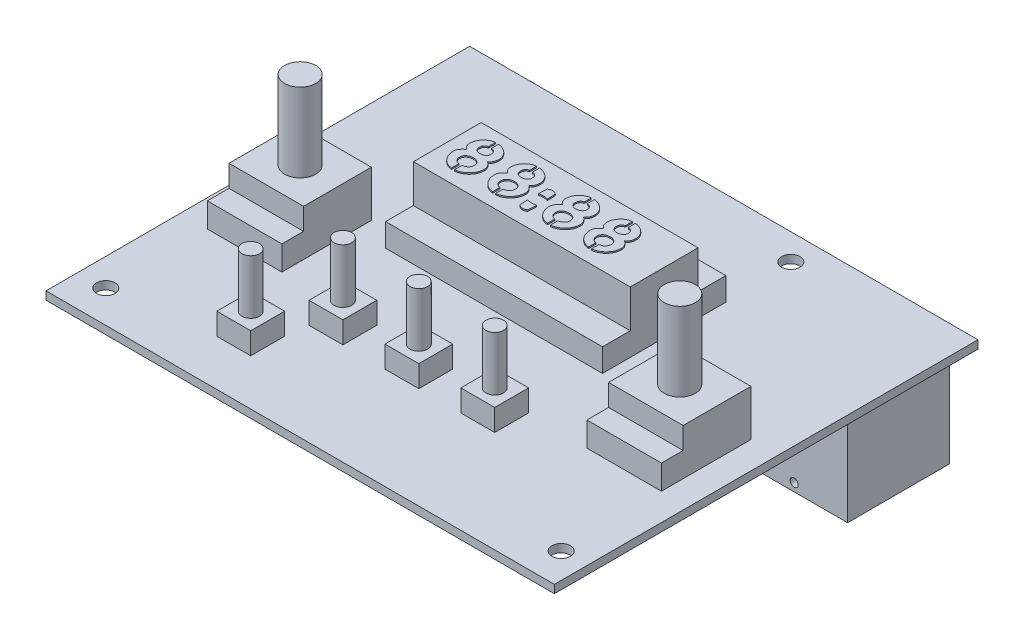
from build123d import *

# Parameters (mm, degrees)
SKETCH1_W                             = 95.25
SKETCH1_H                             = 79.375
BOSS_EXTRUDE1_DEPTH                   = 1.524
F_29_0_136_DIAMETER_HOLE1_D           = 3.4544
SKETCH4_W                             = 13.97
SKETCH4_H                             = 16.764
BOSS_EXTRUDE2_DEPTH                   = 4.572
SKETCH5_W                             = 13.97
SKETCH5_H                             = 12.7
BOSS_EXTRUDE3_DEPTH                   = 4.064
SKETCH8_W                             = 6.35
SKETCH8_H                             = 6.35
BOSS_EXTRUDE5_DEPTH                   = 4.064
BOSS_EXTRUDE5_2_DEPTH                 = 4.064
BOSS_EXTRUDE5_3_DEPTH                 = 4.064
BOSS_EXTRUDE5_4_DEPTH                 = 4.064
SKETCH9_R                             = 1.651
BOSS_EXTRUDE6_DEPTH                   = 10.16
BOSS_EXTRUDE6_2_DEPTH                 = 10.16
BOSS_EXTRUDE6_3_DEPTH                 = 10.16
BOSS_EXTRUDE6_4_DEPTH                 = 10.16
SKETCH10_R                            = 2.921
BOSS_EXTRUDE7_DEPTH                   = 14.732
BOSS_EXTRUDE7_2_DEPTH                 = 14.732
SKETCH11_W                            = 20.0152
SKETCH11_H                            = 21.336
BOSS_EXTRUDE8_DEPTH                   = 19.05
SKETCH12_R                            = 6.985
CUT_EXTRUDE1_DEPTH                    = 3.175
SKETCH14_W                            = 0.75565
SKETCH14_H                            = 79.375
F_53_0_0595_DIAMETER_HOLE1_AT_2_COUNT = 2
F_53_0_0595_DIAMETER_HOLE1_AT_2_PITCH = 17.4879
F_53_0_0595_DIAMETER_HOLE1_AT_3_COUNT = 2
F_53_0_0595_DIAMETER_HOLE1_AT_3_PITCH = 16.783370835
SKETCH15_W                            = 5.969
SKETCH15_H                            = 5.334
BOSS_EXTRUDE9_DEPTH                   = 13.97
SKETCH16_R                            = 2.54
SKETCH16_R_2                          = 1.778
BOSS_EXTRUDE10_DEPTH                  = 2.032
BOSS_EXTRUDE10_DRAFT                  = 9
SKETCH17_R                            = 1.778
CUT_EXTRUDE2_DEPTH                    = 12.7
SKETCH18_W                            = 40.64
SKETCH18_H                            = 23.114
BOSS_EXTRUDE11_DEPTH                  = 4.318
SKETCH19_W                            = 40.64
SKETCH19_H                            = 12.7
BOSS_EXTRUDE12_DEPTH                  = 7.112
SKETCH20_W                            = 33.02
SKETCH20_H                            = 2.410000006
BOSS_EXTRUDE13_DEPTH                  = 2.54
SKETCH21_W                            = 8.89
SKETCH21_H                            = 4.572
BOSS_EXTRUDE14_DEPTH                  = 4.826
SKETCH22_W                            = 8.89
SKETCH22_H                            = 2.032
BOSS_EXTRUDE15_DEPTH                  = 1.524
BOSS_EXTRUDE16_DEPTH                  = 0.254


with BuildPart() as part:
    # Sketch1 → Boss-Extrude1 (new body)
    with BuildSketch(Plane(origin=(0, 0, 0), x_dir=(1, 0, 0), z_dir=(0, 1, 0))):
        Rectangle(SKETCH1_W, SKETCH1_H)
    extrude(amount=BOSS_EXTRUDE1_DEPTH)

    # #29 (0.136) Diameter Hole1 (through all)
    with Locations(Plane(origin=(0, 1.524, 0), x_dir=(1, 0, 0), z_dir=(0, 1, 0))):
        with Locations((42.8498, -33.6423), (17.4498, 34.7853), (-25.8318, 22.2123), (-42.4688, -33.6423)):
            Hole(F_29_0_136_DIAMETER_HOLE1_D / 2)

    # Sketch4 → Boss-Extrude2 (add)
    with BuildSketch(Plane(origin=(0, 1.524, 0), x_dir=(1, 0, 0), z_dir=(0, 1, 0))):
        with Locations((35.56, -6.1595)):
            Rectangle(SKETCH4_W, SKETCH4_H)
        with Locations((-35.56, -6.1595)):
            Rectangle(SKETCH4_W, SKETCH4_H)
    extrude(amount=BOSS_EXTRUDE2_DEPTH)

    # Sketch5 → Boss-Extrude3 (add)
    with BuildSketch(Plane(origin=(0, 6.096, 0), x_dir=(1, 0, 0), z_dir=(0, 1, 0))):
        with Locations((-35.56, -4.1275)):
            Rectangle(SKETCH5_W, SKETCH5_H)
        with Locations((35.56, -4.1275)):
            Rectangle(SKETCH5_W, SKETCH5_H)
    extrude(amount=BOSS_EXTRUDE3_DEPTH)

    # Sketch15 → Boss-Extrude9 (add)
    with BuildSketch(Plane(origin=(0, 0, -39.6875), x_dir=(-1, 0, 0), z_dir=(0, 0, -1))):
        with Locations((37.9095, -2.667)):
            Rectangle(SKETCH15_W, SKETCH15_H)
    extrude(amount=-BOSS_EXTRUDE9_DEPTH)


with BuildPart() as body_2:
    # Sketch8 → Boss-Extrude5 (new body)
    with BuildSketch(Plane(origin=(0, 1.524, 0), x_dir=(1, 0, 0), z_dir=(0, 1, 0))):
        with Locations((-21.082, -27.8765)):
            Rectangle(SKETCH8_W, SKETCH8_H)
    extrude(amount=BOSS_EXTRUDE5_DEPTH)


with BuildPart() as body_3:
    # Sketch8 → Boss-Extrude5 2 (new body)
    with BuildSketch(Plane(origin=(0, 1.524, 0), x_dir=(1, 0, 0), z_dir=(0, 1, 0))):
        with Locations((14.224, -17.4625)):
            Rectangle(SKETCH8_W, SKETCH8_H)
    extrude(amount=BOSS_EXTRUDE5_2_DEPTH)


with BuildPart() as body_4:
    # Sketch8 → Boss-Extrude5 3 (new body)
    with BuildSketch(Plane(origin=(0, 1.524, 0), x_dir=(1, 0, 0), z_dir=(0, 1, 0))):
        with Locations((0, -17.4625)):
            Rectangle(SKETCH8_W, SKETCH8_H)
    extrude(amount=BOSS_EXTRUDE5_3_DEPTH)


with BuildPart() as body_5:
    # Sketch8 → Boss-Extrude5 4 (new body)
    with BuildSketch(Plane(origin=(0, 1.524, 0), x_dir=(1, 0, 0), z_dir=(0, 1, 0))):
        with Locations((-14.224, -17.4625)):
            Rectangle(SKETCH8_W, SKETCH8_H)
    extrude(amount=BOSS_EXTRUDE5_4_DEPTH)


with BuildPart() as body_6:
    # Sketch9 → Boss-Extrude6 (new body)
    with BuildSketch(Plane(origin=(0, 5.588, 0), x_dir=(1, 0, 0), z_dir=(0, 1, 0))):
        with Locations((-21.082, -27.8765)):
            Circle(SKETCH9_R)
    extrude(amount=BOSS_EXTRUDE6_DEPTH)


with BuildPart() as body_7:
    # Sketch9 → Boss-Extrude6 2 (new body)
    with BuildSketch(Plane(origin=(0, 5.588, 0), x_dir=(1, 0, 0), z_dir=(0, 1, 0))):
        with Locations((-14.224, -17.4625)):
            Circle(SKETCH9_R)
    extrude(amount=BOSS_EXTRUDE6_2_DEPTH)


with BuildPart() as body_8:
    # Sketch9 → Boss-Extrude6 3 (new body)
    with BuildSketch(Plane(origin=(0, 5.588, 0), x_dir=(1, 0, 0), z_dir=(0, 1, 0))):
        with Locations((0, -17.4625)):
            Circle(SKETCH9_R)
    extrude(amount=BOSS_EXTRUDE6_3_DEPTH)


with BuildPart() as body_9:
    # Sketch9 → Boss-Extrude6 4 (new body)
    with BuildSketch(Plane(origin=(0, 5.588, 0), x_dir=(1, 0, 0), z_dir=(0, 1, 0))):
        with Locations((14.224, -17.4625)):
            Circle(SKETCH9_R)
    extrude(amount=BOSS_EXTRUDE6_4_DEPTH)


with BuildPart() as body_10:
    # Sketch10 → Boss-Extrude7 (new body)
    with BuildSketch(Plane(origin=(0, 10.16, 0), x_dir=(1, 0, 0), z_dir=(0, 1, 0))):
        with Locations((-35.56, -4.1275)):
            Circle(SKETCH10_R)
    extrude(amount=BOSS_EXTRUDE7_DEPTH)


with BuildPart() as body_11:
    # Sketch10 → Boss-Extrude7 2 (new body)
    with BuildSketch(Plane(origin=(0, 10.16, 0), x_dir=(1, 0, 0), z_dir=(0, 1, 0))):
        with Locations((35.56, -4.1275)):
            Circle(SKETCH10_R)
    extrude(amount=BOSS_EXTRUDE7_2_DEPTH)


with BuildPart() as body_12:
    # Sketch11 → Boss-Extrude8 (new body)
    with BuildSketch(Plane(origin=(0, 0, -39.6875), x_dir=(-1, 0, 0), z_dir=(0, 0, -1))):
        with Locations((-32.2326, -10.668)):
            Rectangle(SKETCH11_W, SKETCH11_H)
    extrude(amount=-BOSS_EXTRUDE8_DEPTH)

    # Sketch12 → Cut-Extrude1 (cut)
    with BuildSketch(Plane(origin=(0, 0, -39.6875), x_dir=(-1, 0, 0), z_dir=(0, 0, -1))):
        with Locations((-32.2326, -10.541)):
            Circle(SKETCH12_R)
    extrude(amount=-CUT_EXTRUDE1_DEPTH, mode=Mode.SUBTRACT)

    # Sketch14 → #53 (0.0595) Diameter Hole1 (revolve, cut)
    with BuildSketch(Plane(origin=(40.97655, -5.492678114, -39.6875), x_dir=(0, 1, 0), z_dir=(1, 0, 0))):
        with Locations((0.377825, 39.6875)):
            Rectangle(SKETCH14_W, SKETCH14_H)
    f_53_0_0595_diameter_hole1 = revolve(axis=Axis((40.97655, -5.492678114, -46.0375), (0, 0, 1)), mode=Mode.SUBTRACT)

    # #53 (0.0595) Diameter Hole1 at 2: #53 (0.0595) Diameter Hole1 ×2
    with Locations(*[(-i * F_53_0_0595_DIAMETER_HOLE1_AT_2_PITCH, 0, 0) for i in range(1, F_53_0_0595_DIAMETER_HOLE1_AT_2_COUNT)]):
        add(f_53_0_0595_diameter_hole1, mode=Mode.SUBTRACT)

    # #53 (0.0595) Diameter Hole1 at 3: #53 (0.0595) Diameter Hole1 ×2
    with Locations(*[Vector(-0.5209889053752342, -0.8535634484184028, 0) * (i * F_53_0_0595_DIAMETER_HOLE1_AT_3_PITCH) for i in range(1, F_53_0_0595_DIAMETER_HOLE1_AT_3_COUNT)]):
        add(f_53_0_0595_diameter_hole1, mode=Mode.SUBTRACT)


with BuildPart() as boss_extrude10_tool:
    # Sketch16 → Boss-Extrude10 (with draft: the straight prism first)
    with BuildSketch(Plane(origin=(0, 0, -39.6875), x_dir=(-1, 0, 0), z_dir=(0, 0, -1))):
        with Locations((37.9095, -2.667)):
            Circle(SKETCH16_R)
        with Locations((37.9095, -2.667)):
            Circle(SKETCH16_R_2, mode=Mode.SUBTRACT)
    extrude(amount=BOSS_EXTRUDE10_DEPTH)
    # Boss-Extrude10: the draft: its side faces are tilted about the plane it starts from
    boss_extrude10_sides = [boss_extrude10_tool.faces().sort_by_distance(p)[0] for p in [
        (-35.3695, -2.667, -40.7035),
        (-36.1315, -2.667, -40.7035),
    ]]
    draft(boss_extrude10_sides, Plane(origin=(0, 0, -39.6875), x_dir=(-1, 0, 0), z_dir=(0, 0, -1)), BOSS_EXTRUDE10_DRAFT)


with BuildPart() as part_1:
    add(part.part)

    # Boss-Extrude10: add boss_extrude10_tool
    add(boss_extrude10_tool.part)

    # Sketch17 → Cut-Extrude2 (cut)
    with BuildSketch(Plane(origin=(0, 0, -39.6875), x_dir=(-1, 0, 0), z_dir=(0, 0, -1))):
        with Locations((37.9095, -2.667)):
            Circle(SKETCH17_R)
    extrude(amount=-CUT_EXTRUDE2_DEPTH, mode=Mode.SUBTRACT)

    # Sketch18 → Boss-Extrude11 (add)
    with BuildSketch(Plane(origin=(0, 1.524, 0), x_dir=(1, 0, 0), z_dir=(0, 1, 0))):
        with Locations((-2.413, 10.6045)):
            Rectangle(SKETCH18_W, SKETCH18_H)
    extrude(amount=BOSS_EXTRUDE11_DEPTH)

    # Sketch19 → Boss-Extrude12 (add)
    with BuildSketch(Plane(origin=(0, 5.842, 0), x_dir=(1, 0, 0), z_dir=(0, 1, 0))):
        with Locations((-2.413, 10.6045)):
            Rectangle(SKETCH19_W, SKETCH19_H)
    extrude(amount=BOSS_EXTRUDE12_DEPTH)

    # Sketch20 → Boss-Extrude13 (add)
    with BuildSketch(Plane.XZ):
        with Locations((1.143, 34.672499997)):
            Rectangle(SKETCH20_W, SKETCH20_H)
    extrude(amount=BOSS_EXTRUDE13_DEPTH)

    # Sketch23 → Boss-Extrude16 (add)
    with BuildSketch(Plane(origin=(0, 12.954, 0), x_dir=(1, 0, 0), z_dir=(0, 1, 0))):
        with BuildLine():
            add(Edge.make_bspline(
                [(-14.59275285, 9.458275193), (-14.5958246, 9.535342211), (-14.601907288, 9.687950501), (-14.659415351, 9.91079508), (-14.748348029, 10.124090882), (-14.874410596, 10.32311803), (-15.020929076, 10.508695552), (-15.183091741, 10.678410699), (-15.35465531, 10.834358631), (-15.481467044, 10.921313393), (-15.544721308, 10.96468682)],
                knots=[0, 0, 0, 0, 0.995318931, 1.970932874, 2.958210881, 3.97438322, 5.007739601, 6.01292083, 7.008835956, 8, 8, 8, 8], degree=3))
            add(Edge.make_bspline(
                [(-15.544721308, 10.96468682), (-15.488142585, 10.998844815), (-15.375435373, 11.066888986), (-15.230415733, 11.202781299), (-15.103788521, 11.359908716), (-15.003931699, 11.541267209), (-14.922639254, 11.733648116), (-14.864933941, 11.932678891), (-14.82849111, 12.134423619), (-14.823604093, 12.270440932), (-14.821155539, 12.338590016)],
                knots=[0, 0, 0, 0, 0.973206171, 1.938667874, 2.915384234, 3.941165853, 4.983177624, 5.993087763, 6.994471904, 8, 8, 8, 8], degree=3))
            Line((-14.821155539, 12.338590016), (-14.821155539, 12.446688998))
            add(Edge.make_bspline(
                [(-14.821155539, 12.446688998), (-14.8239245, 12.525894752), (-14.829396746, 12.682427594), (-14.870279656, 12.912204597), (-14.938584682, 13.132604658), (-15.035852874, 13.341299205), (-15.152985917, 13.539346621), (-15.285787755, 13.727206328), (-15.436361413, 13.902411714), (-15.604371037, 14.063166722), (-15.783351949, 14.214594497), (-15.97747972, 14.347834251), (-16.18258586, 14.468101734), (-16.399438047, 14.568838363), (-16.621674946, 14.656403694), (-16.847259038, 14.725922398), (-17.074233765, 14.780051383), (-17.227575784, 14.799492513), (-17.303945071, 14.809174825)],
                knots=[0, 0, 0, 0, 1.017484137, 2.010834781, 2.988792481, 3.974674747, 4.962252912, 5.942460988, 6.927522522, 7.925774482, 8.927930235, 9.936881282, 10.947572307, 11.97991419, 13.006240961, 14.014943195, 15.01137748, 16, 16, 16, 16], degree=3))
            add(Edge.make_bspline(
                [(-17.303945071, 14.809174825), (-17.318183916, 14.807140704), (-17.346661604, 14.803072463), (-17.350729846, 14.774594774), (-17.352763966, 14.760355929)],
                knots=[0, 0, 0, 0, 1, 2, 2, 2, 2], degree=3))
            add(Edge.make_bspline(
                [(-17.352763966, 14.760355929), (-17.349422635, 14.655752491), (-17.342759609, 14.447160362), (-17.341291256, 14.238467072), (-17.340559243, 14.13442795)],
                knots=[0, 0, 0, 0, 1.002947133, 2, 2, 2, 2], degree=3))
            add(Edge.make_bspline(
                [(-17.340559243, 14.13442795), (-17.340559243, 14.032721918), (-17.340559243, 13.827566323), (-17.340559243, 13.622410727), (-17.340559243, 13.518961163)],
                knots=[0, 0, 0, 0, 0.991501416, 2, 2, 2, 2], degree=3))
            add(Edge.make_bspline(
                [(-17.340559243, 13.518961163), (-17.338353102, 13.505447516), (-17.333842295, 13.477816706), (-17.305977207, 13.473891348), (-17.291740347, 13.4718858)],
                knots=[0, 0, 0, 0, 0.978157849, 2, 2, 2, 2], degree=3))
            add(Edge.make_bspline(
                [(-17.291740347, 13.4718858), (-17.234917586, 13.463963561), (-17.121890648, 13.448205326), (-16.960820838, 13.3898859), (-16.80876771, 13.31111665), (-16.67032309, 13.20905014), (-16.550416625, 13.087064302), (-16.462657026, 12.942454003), (-16.410145833, 12.778563696), (-16.403984681, 12.663280477), (-16.400795508, 12.603606876)],
                knots=[0, 0, 0, 0, 1.005745738, 2.000542698, 2.99182103, 4.007011567, 5.011044689, 5.977873494, 6.953294593, 8, 8, 8, 8], degree=3))
            Line((-16.400795508, 12.603606876), (-16.400795508, 12.542583257))
            add(Edge.make_bspline(
                [(-16.400795508, 12.542583257), (-16.400250981, 12.533864088), (-16.399014446, 12.514064215), (-16.39619471, 12.483144513), (-16.389685936, 12.452121369), (-16.388933033, 12.431605497), (-16.388590784, 12.422279551)],
                knots=[0, 0, 0, 0, 0.866411576, 1.967485452, 3.076075278, 4, 4, 4, 4], degree=3))
            add(Edge.make_bspline(
                [(-16.388590784, 12.422279551), (-16.389969507, 12.389042581), (-16.392677943, 12.323750134), (-16.413034892, 12.228345167), (-16.443230373, 12.137076891), (-16.505376931, 12.026230039), (-16.603890919, 11.900325399), (-16.754483001, 11.778587549), (-16.927813235, 11.683112936), (-17.115240372, 11.610421598), (-17.311260988, 11.566253627), (-17.443225311, 11.559202103), (-17.507938312, 11.555744159)],
                knots=[0, 0, 0, 0, 0.637370974, 1.252084947, 1.865887407, 2.47480542, 3.682072335, 4.910335882, 6.163867148, 7.466846277, 8.757785619, 10, 10, 10, 10], degree=3))
            Line((-17.507938312, 11.555744159), (-17.701470361, 11.555744159))
            add(Edge.make_bspline(
                [(-17.701470361, 11.555744159), (-17.761056063, 11.559402073), (-17.880456769, 11.566731977), (-18.053629574, 11.616528895), (-18.212993498, 11.697684451), (-18.355032729, 11.80416109), (-18.474604521, 11.934204901), (-18.567233385, 12.082463334), (-18.631247306, 12.24711465), (-18.637887614, 12.363583391), (-18.641234096, 12.422279551)],
                knots=[0, 0, 0, 0, 1.013450506, 2.030801042, 3.03907653, 4.041760303, 5.035530285, 6.026047973, 7.005197428, 8, 8, 8, 8], degree=3))
            Line((-18.641234096, 12.422279551), (-18.641234096, 12.603606876))
            add(Edge.make_bspline(
                [(-18.641234096, 12.603606876), (-18.639645093, 12.654985975), (-18.636518045, 12.756096471), (-18.598974817, 12.902776884), (-18.543101979, 13.042358356), (-18.465586332, 13.172278948), (-18.367822656, 13.285938434), (-18.249319317, 13.373625191), (-18.11441684, 13.435265096), (-18.016492794, 13.45142759), (-17.966487222, 13.459681076)],
                knots=[0, 0, 0, 0, 1.030008905, 2.026985943, 3.022320288, 4.043687467, 5.053237222, 6.013141971, 6.985397581, 8, 8, 8, 8], degree=3))
            add(Edge.make_bspline(
                [(-17.966487222, 13.459681076), (-17.952250361, 13.461686624), (-17.924385274, 13.465611982), (-17.919874467, 13.493242792), (-17.917668326, 13.506756439)],
                knots=[0, 0, 0, 0, 1.021842151, 2, 2, 2, 2], degree=3))
            add(Edge.make_bspline(
                [(-17.917668326, 13.506756439), (-17.914169391, 13.561367895), (-17.907473605, 13.665875865), (-17.907293246, 13.770594907), (-17.907207134, 13.820592195)],
                knots=[0, 0, 0, 0, 1.045115631, 2, 2, 2, 2], degree=3))
            add(Edge.make_bspline(
                [(-17.907207134, 13.820592195), (-17.907207134, 13.872898154), (-17.907207134, 13.977510072), (-17.907207134, 14.082121991), (-17.907207134, 14.13442795)],
                knots=[0, 0, 0, 0, 1, 2, 2, 2, 2], degree=3))
            add(Edge.make_bspline(
                [(-17.907207134, 14.13442795), (-17.90671813, 14.18382915), (-17.905728516, 14.28380379), (-17.902495609, 14.436089916), (-17.895726318, 14.591183988), (-17.895243673, 14.695837408), (-17.895002411, 14.748151205)],
                knots=[0, 0, 0, 0, 0.965744349, 1.954404832, 2.977454803, 4, 4, 4, 4], degree=3))
            add(Edge.make_bspline(
                [(-17.895002411, 14.748151205), (-17.897007959, 14.762388066), (-17.900933317, 14.790253153), (-17.928564127, 14.79476396), (-17.942077774, 14.796970101)],
                knots=[0, 0, 0, 0, 1.021842151, 2, 2, 2, 2], degree=3))
            add(Edge.make_bspline(
                [(-17.942077774, 14.796970101), (-18.013798664, 14.789168238), (-18.156770398, 14.773615643), (-18.36701708, 14.723514977), (-18.571581628, 14.653245781), (-18.770089233, 14.564648838), (-18.958689867, 14.458051783), (-19.138681042, 14.339337912), (-19.305426231, 14.20424449), (-19.462648362, 14.05792206), (-19.608182956, 13.899856308), (-19.736933006, 13.726548572), (-19.856074737, 13.544812961), (-19.958504553, 13.351531066), (-20.043822774, 13.150748487), (-20.112503603, 12.945313474), (-20.160488286, 12.734392292), (-20.176313896, 12.591608644), (-20.184259894, 12.519917341)],
                knots=[0, 0, 0, 0, 1.001021632, 1.995482755, 2.99337639, 4.001271291, 5.009327732, 5.998667133, 6.991850302, 7.985394085, 8.979396645, 9.970446227, 10.980019879, 11.994516817, 13.003348289, 14.006319965, 14.998978368, 16, 16, 16, 16], degree=3))
            Line((-20.184259894, 12.519917341), (-20.196464618, 12.507712618))
            add(Edge.make_bspline(
                [(-20.196464618, 12.507712618), (-20.199810506, 12.490327159), (-20.206793455, 12.454043288), (-20.208026902, 12.417107872), (-20.208669341, 12.397870103)],
                knots=[0, 0, 0, 0, 0.958302254, 2, 2, 2, 2], degree=3))
            add(Edge.make_bspline(
                [(-20.208669341, 12.397870103), (-20.208669341, 12.381015961), (-20.208669341, 12.344982966), (-20.208669341, 12.308949972), (-20.208669341, 12.289771121)],
                knots=[0, 0, 0, 0, 0.935483871, 2, 2, 2, 2], degree=3))
            add(Edge.make_bspline(
                [(-20.208669341, 12.289771121), (-20.206528727, 12.22562717), (-20.202247588, 12.097341909), (-20.160954853, 11.907970565), (-20.100236811, 11.720729723), (-20.013377968, 11.540069363), (-19.906744148, 11.370999115), (-19.78285692, 11.218698933), (-19.644054069, 11.084336806), (-19.53797087, 11.012628083), (-19.485103572, 10.976891543)],
                knots=[0, 0, 0, 0, 0.985024158, 1.970007775, 2.967600018, 4.006910369, 5.043258017, 6.034223535, 7.020341646, 8, 8, 8, 8], degree=3))
            add(Edge.make_bspline(
                [(-19.485103572, 10.976891543), (-19.547925168, 10.93123187), (-19.674092358, 10.839531675), (-19.852519213, 10.686222048), (-20.017478542, 10.515016648), (-20.174955049, 10.335774348), (-20.308898622, 10.1409276), (-20.405427994, 9.928957023), (-20.462405878, 9.703606729), (-20.469902536, 9.548675718), (-20.473686202, 9.470479917)],
                knots=[0, 0, 0, 0, 0.993652422, 1.995592932, 3.005397526, 4.033954309, 5.046794601, 6.018720914, 7.000021345, 8, 8, 8, 8], degree=3))
            add(Edge.make_bspline(
                [(-20.473686202, 9.470479917), (-20.473158629, 9.450724983), (-20.472133763, 9.412348944), (-20.469702226, 9.355076607), (-20.459472462, 9.298380219), (-20.452746923, 9.260090172), (-20.449276754, 9.240333696)],
                knots=[0, 0, 0, 0, 1.023069621, 1.987420469, 2.961571409, 4, 4, 4, 4], degree=3))
            Line((-20.449276754, 9.240333696), (-20.449276754, 9.25253842))
            add(Edge.make_bspline(
                [(-20.449276754, 9.25253842), (-20.443514339, 9.170366071), (-20.43198951, 9.006021373), (-20.382331657, 8.763096319), (-20.314587415, 8.522578183), (-20.224329902, 8.286723099), (-20.11307083, 8.059718928), (-19.98447706, 7.844048278), (-19.842331886, 7.639171106), (-19.681006244, 7.449111589), (-19.505657309, 7.27337224), (-19.315967536, 7.113674148), (-19.113309577, 6.970293269), (-18.898086179, 6.844576307), (-18.670920154, 6.741537351), (-18.435259689, 6.662204406), (-18.19101118, 6.611130124), (-18.025401657, 6.597182584), (-17.942077774, 6.590165094)],
                knots=[0, 0, 0, 0, 0.991093162, 1.982186323, 2.979193569, 3.998313328, 5.018802209, 6.019928527, 7.019953186, 8.018310808, 9.018065988, 10.006560611, 11.000861602, 12.004480536, 13.003721054, 13.999745058, 14.993602505, 16, 16, 16, 16], degree=3))
            add(Edge.make_bspline(
                [(-17.942077774, 6.590165094), (-17.928565401, 6.592344509), (-17.901540655, 6.596703339), (-17.897181826, 6.623728085), (-17.895002411, 6.637240458)],
                knots=[0, 0, 0, 0, 1, 2, 2, 2, 2], degree=3))
            Line((-17.895002411, 6.637240458), (-17.895002411, 7.277116692))
            add(Edge.make_bspline(
                [(-17.895002411, 7.277116692), (-17.895211762, 7.332336936), (-17.895621747, 7.440478166), (-17.902628482, 7.601961098), (-17.905782165, 7.763549467), (-17.90672712, 7.87224127), (-17.907207134, 7.927454119)],
                knots=[0, 0, 0, 0, 1.018600088, 1.99478774, 2.981399912, 4, 4, 4, 4], degree=3))
            add(Edge.make_bspline(
                [(-17.907207134, 7.927454119), (-17.909212683, 7.941690979), (-17.913138041, 7.969556066), (-17.940768851, 7.974066874), (-17.954282498, 7.976273014)],
                knots=[0, 0, 0, 0, 1.021842151, 2, 2, 2, 2], degree=3))
            add(Edge.make_bspline(
                [(-17.954282498, 7.976273014), (-18.020564007, 7.980444737), (-18.150273562, 7.988608586), (-18.332626027, 8.058503593), (-18.489278479, 8.166459039), (-18.628420501, 8.295935569), (-18.738732643, 8.452014474), (-18.821082747, 8.624491382), (-18.870689668, 8.809911103), (-18.87813759, 8.93668198), (-18.881841508, 8.999726284)],
                knots=[0, 0, 0, 0, 1.03923749, 2.033735126, 3.022001828, 4.017254619, 5.006070206, 6.007343738, 7.009034032, 8, 8, 8, 8], degree=3))
            Line((-18.881841508, 8.999726284), (-18.881841508, 9.072954627))
            add(Edge.make_bspline(
                [(-18.881841508, 9.072954627), (-18.882041678, 9.081150518), (-18.882432121, 9.097137049), (-18.889619503, 9.120353269), (-18.89254183, 9.14436645), (-18.89354603, 9.160708656), (-18.894046232, 9.168848885)],
                knots=[0, 0, 0, 0, 1.010575764, 1.971182807, 2.989424236, 4, 4, 4, 4], degree=3))
            add(Edge.make_bspline(
                [(-18.894046232, 9.168848885), (-18.892849636, 9.208488542), (-18.890509184, 9.286020746), (-18.867780736, 9.399248091), (-18.836015675, 9.507689361), (-18.771486716, 9.642858438), (-18.665574392, 9.798935747), (-18.501397626, 9.957836715), (-18.309398837, 10.087278791), (-18.095671035, 10.179792093), (-17.871195813, 10.242626837), (-17.716985749, 10.249776958), (-17.640446742, 10.253325774)],
                knots=[0, 0, 0, 0, 0.64801719, 1.26747319, 1.884367176, 2.492990243, 3.712019454, 4.949835234, 6.211045677, 7.480267519, 8.749382399, 10, 10, 10, 10], degree=3))
            Line((-17.640446742, 10.253325774), (-17.556757207, 10.253325774))
            add(Edge.make_bspline(
                [(-17.556757207, 10.253325774), (-17.5451268, 10.253779885), (-17.522977751, 10.254644698), (-17.490340558, 10.257967399), (-17.458221098, 10.265021943), (-17.435917997, 10.265355813), (-17.424248777, 10.265530498)],
                knots=[0, 0, 0, 0, 1.048304645, 1.996400496, 2.951695355, 4, 4, 4, 4], degree=3))
            add(Edge.make_bspline(
                [(-17.424248777, 10.265530498), (-17.347723276, 10.261905963), (-17.192414077, 10.254549937), (-16.965143277, 10.191772377), (-16.7491203, 10.100271227), (-16.554512404, 9.974930271), (-16.386289555, 9.81998795), (-16.283129606, 9.659668022), (-16.21608135, 9.52200222), (-16.184582859, 9.409071656), (-16.161995691, 9.291216212), (-16.159645421, 9.210228897), (-16.158444563, 9.168848885)],
                knots=[0, 0, 0, 0, 1.234039438, 2.504494217, 3.782693636, 5.011688637, 6.226839427, 7.445285228, 8.066822692, 8.693513545, 9.332458123, 10, 10, 10, 10], degree=3))
            add(Edge.make_bspline(
                [(-16.158444563, 9.168848885), (-16.158732738, 9.16009277), (-16.159332964, 9.141855086), (-16.166019388, 9.114983933), (-16.169095375, 9.087549383), (-16.170143553, 9.069472026), (-16.170649287, 9.060749903)],
                knots=[0, 0, 0, 0, 0.962594109, 2.00494014, 3.037405891, 4, 4, 4, 4], degree=3))
            add(Edge.make_bspline(
                [(-16.170649287, 9.060749903), (-16.176456254, 8.988764192), (-16.187835496, 8.847702111), (-16.254792789, 8.645993486), (-16.361861683, 8.463248504), (-16.505050683, 8.303042663), (-16.672761259, 8.167880265), (-16.857863247, 8.064162756), (-17.056702028, 7.990527824), (-17.196405476, 7.972978055), (-17.2673309, 7.964068291)],
                knots=[0, 0, 0, 0, 1.019336045, 1.997475105, 2.978067161, 3.998033706, 5.021973388, 6.012760731, 6.991107325, 8, 8, 8, 8], degree=3))
            add(Edge.make_bspline(
                [(-17.2673309, 7.964068291), (-17.281569744, 7.96203417), (-17.310047433, 7.957965929), (-17.314115674, 7.92948824), (-17.316149795, 7.915249395)],
                knots=[0, 0, 0, 0, 1, 2, 2, 2, 2], degree=3))
            add(Edge.make_bspline(
                [(-17.316149795, 7.915249395), (-17.316368341, 7.860029425), (-17.316798634, 7.751307814), (-17.323707649, 7.589821897), (-17.326956213, 7.428236126), (-17.32788181, 7.320124994), (-17.328354519, 7.264911969)],
                knots=[0, 0, 0, 0, 1.018600902, 2.005505097, 2.981399098, 4, 4, 4, 4], degree=3))
            add(Edge.make_bspline(
                [(-17.328354519, 7.264911969), (-17.328354519, 7.211443655), (-17.328354519, 7.102763495), (-17.328354519, 6.994083335), (-17.328354519, 6.938871489)],
                knots=[0, 0, 0, 0, 0.983957219, 2, 2, 2, 2], degree=3))
            add(Edge.make_bspline(
                [(-17.328354519, 6.938871489), (-17.329121302, 6.885969599), (-17.330689489, 6.777777375), (-17.33722126, 6.669770272), (-17.340559243, 6.614574542)],
                knots=[0, 0, 0, 0, 0.977924061, 2, 2, 2, 2], degree=3))
            add(Edge.make_bspline(
                [(-17.340559243, 6.614574542), (-17.338525122, 6.600335697), (-17.334456881, 6.571858009), (-17.305979192, 6.567789767), (-17.291740347, 6.565755647)],
                knots=[0, 0, 0, 0, 1, 2, 2, 2, 2], degree=3))
            add(Edge.make_bspline(
                [(-17.291740347, 6.565755647), (-17.2077476, 6.575615799), (-17.039397296, 6.595378929), (-16.791948824, 6.657003491), (-16.547398429, 6.737250696), (-16.308594488, 6.840049108), (-16.077243736, 6.961123899), (-15.859101495, 7.101354724), (-15.653652646, 7.256718146), (-15.463752378, 7.430247956), (-15.287741848, 7.61712513), (-15.130738316, 7.819576364), (-14.988362926, 8.031829033), (-14.866965164, 8.257591691), (-14.762366827, 8.492734002), (-14.685220421, 8.738566631), (-14.628798007, 8.99231323), (-14.612969153, 9.165089725), (-14.604957574, 9.25253842)],
                knots=[0, 0, 0, 0, 0.984994069, 1.974266293, 2.96624927, 3.983093936, 5.001382152, 6.006877751, 7.002855415, 8.000490893, 9.002327637, 9.991715857, 10.983883914, 11.978270245, 12.976457716, 13.979233314, 14.977213824, 16, 16, 16, 16], degree=3))
            Line((-14.604957574, 9.25253842), (-14.604957574, 9.240333696))
            add(Edge.make_bspline(
                [(-14.604957574, 9.240333696), (-14.601626723, 9.259466271), (-14.59529535, 9.295833993), (-14.59357035, 9.332703337), (-14.59275285, 9.350176211)],
                knots=[0, 0, 0, 0, 1.052173348, 2, 2, 2, 2], degree=3))
            add(Edge.make_bspline(
                [(-14.59275285, 9.350176211), (-14.59275285, 9.367030353), (-14.59275285, 9.403063347), (-14.59275285, 9.439096341), (-14.59275285, 9.458275193)],
                knots=[0, 0, 0, 0, 0.935483871, 2, 2, 2, 2], degree=3))
        make_face()
        with BuildLine():
            add(Edge.make_bspline(
                [(-6.893315648, 9.458275193), (-6.896387399, 9.535342211), (-6.902470086, 9.687950501), (-6.959978149, 9.91079508), (-7.048910828, 10.124090882), (-7.174973394, 10.32311803), (-7.321491875, 10.508695552), (-7.48365454, 10.678410699), (-7.655218108, 10.834358631), (-7.782029842, 10.921313393), (-7.845284107, 10.96468682)],
                knots=[0, 0, 0, 0, 0.995318931, 1.970932874, 2.958210881, 3.97438322, 5.007739601, 6.01292083, 7.008835956, 8, 8, 8, 8], degree=3))
            add(Edge.make_bspline(
                [(-7.845284107, 10.96468682), (-7.788705383, 10.998844815), (-7.675998171, 11.066888986), (-7.530978532, 11.202781299), (-7.404351319, 11.359908716), (-7.304494498, 11.541267209), (-7.223202053, 11.733648116), (-7.16549674, 11.932678891), (-7.129053909, 12.134423619), (-7.124166891, 12.270440932), (-7.121718337, 12.338590016)],
                knots=[0, 0, 0, 0, 0.973206171, 1.938667874, 2.915384234, 3.941165853, 4.983177624, 5.993087763, 6.994471904, 8, 8, 8, 8], degree=3))
            Line((-7.121718337, 12.338590016), (-7.121718337, 12.446688998))
            add(Edge.make_bspline(
                [(-7.121718337, 12.446688998), (-7.124487298, 12.525894752), (-7.129959544, 12.682427594), (-7.170842454, 12.912204597), (-7.23914748, 13.132604658), (-7.336415673, 13.341299205), (-7.453548716, 13.539346621), (-7.586350553, 13.727206328), (-7.736924212, 13.902411714), (-7.904933835, 14.063166722), (-8.083914747, 14.214594497), (-8.278042518, 14.347834251), (-8.483148658, 14.468101734), (-8.700000845, 14.568838363), (-8.922237745, 14.656403694), (-9.147821837, 14.725922398), (-9.374796563, 14.780051383), (-9.528138582, 14.799492513), (-9.604507869, 14.809174825)],
                knots=[0, 0, 0, 0, 1.017484137, 2.010834781, 2.988792481, 3.974674747, 4.962252912, 5.942460988, 6.927522522, 7.925774482, 8.927930235, 9.936881282, 10.947572307, 11.97991419, 13.006240961, 14.014943195, 15.01137748, 16, 16, 16, 16], degree=3))
            add(Edge.make_bspline(
                [(-9.604507869, 14.809174825), (-9.618746714, 14.807140704), (-9.647224403, 14.803072463), (-9.651292644, 14.774594774), (-9.653326765, 14.760355929)],
                knots=[0, 0, 0, 0, 1, 2, 2, 2, 2], degree=3))
            add(Edge.make_bspline(
                [(-9.653326765, 14.760355929), (-9.649985433, 14.655752491), (-9.643322408, 14.447160362), (-9.641854054, 14.238467072), (-9.641122041, 14.13442795)],
                knots=[0, 0, 0, 0, 1.002947133, 2, 2, 2, 2], degree=3))
            add(Edge.make_bspline(
                [(-9.641122041, 14.13442795), (-9.641122041, 14.032721918), (-9.641122041, 13.827566323), (-9.641122041, 13.622410727), (-9.641122041, 13.518961163)],
                knots=[0, 0, 0, 0, 0.991501416, 2, 2, 2, 2], degree=3))
            add(Edge.make_bspline(
                [(-9.641122041, 13.518961163), (-9.6389159, 13.505447516), (-9.634405093, 13.477816706), (-9.606540006, 13.473891348), (-9.592303146, 13.4718858)],
                knots=[0, 0, 0, 0, 0.978157849, 2, 2, 2, 2], degree=3))
            add(Edge.make_bspline(
                [(-9.592303146, 13.4718858), (-9.535480384, 13.463963561), (-9.422453446, 13.448205326), (-9.261383636, 13.3898859), (-9.109330509, 13.31111665), (-8.970885888, 13.20905014), (-8.850979424, 13.087064302), (-8.763219824, 12.942454003), (-8.710708631, 12.778563696), (-8.704547479, 12.663280477), (-8.701358306, 12.603606876)],
                knots=[0, 0, 0, 0, 1.005745738, 2.000542698, 2.99182103, 4.007011567, 5.011044689, 5.977873494, 6.953294593, 8, 8, 8, 8], degree=3))
            Line((-8.701358306, 12.603606876), (-8.701358306, 12.542583257))
            add(Edge.make_bspline(
                [(-8.701358306, 12.542583257), (-8.70081378, 12.533864088), (-8.699577245, 12.514064215), (-8.696757509, 12.483144513), (-8.690248735, 12.452121369), (-8.689495831, 12.431605497), (-8.689153582, 12.422279551)],
                knots=[0, 0, 0, 0, 0.866411576, 1.967485452, 3.076075278, 4, 4, 4, 4], degree=3))
            add(Edge.make_bspline(
                [(-8.689153582, 12.422279551), (-8.690532306, 12.389042581), (-8.693240742, 12.323750134), (-8.713597691, 12.228345167), (-8.743793171, 12.137076891), (-8.805939729, 12.026230039), (-8.904453717, 11.900325399), (-9.0550458, 11.778587549), (-9.228376033, 11.683112936), (-9.41580317, 11.610421598), (-9.611823786, 11.566253627), (-9.743788109, 11.559202103), (-9.80850111, 11.555744159)],
                knots=[0, 0, 0, 0, 0.637370974, 1.252084947, 1.865887407, 2.47480542, 3.682072335, 4.910335882, 6.163867148, 7.466846277, 8.757785619, 10, 10, 10, 10], degree=3))
            Line((-9.80850111, 11.555744159), (-10.00203316, 11.555744159))
            add(Edge.make_bspline(
                [(-10.00203316, 11.555744159), (-10.061618861, 11.559402073), (-10.181019567, 11.566731977), (-10.354192372, 11.616528895), (-10.513556296, 11.697684451), (-10.655595527, 11.80416109), (-10.77516732, 11.934204901), (-10.867796183, 12.082463334), (-10.931810105, 12.24711465), (-10.938450412, 12.363583391), (-10.941796894, 12.422279551)],
                knots=[0, 0, 0, 0, 1.013450506, 2.030801042, 3.03907653, 4.041760303, 5.035530285, 6.026047973, 7.005197428, 8, 8, 8, 8], degree=3))
            Line((-10.941796894, 12.422279551), (-10.941796894, 12.603606876))
            add(Edge.make_bspline(
                [(-10.941796894, 12.603606876), (-10.940207891, 12.654985975), (-10.937080844, 12.756096471), (-10.899537615, 12.902776884), (-10.843664777, 13.042358356), (-10.76614913, 13.172278948), (-10.668385454, 13.285938434), (-10.549882115, 13.373625191), (-10.414979639, 13.435265096), (-10.317055593, 13.45142759), (-10.26705002, 13.459681076)],
                knots=[0, 0, 0, 0, 1.030008905, 2.026985943, 3.022320288, 4.043687467, 5.053237222, 6.013141971, 6.985397581, 8, 8, 8, 8], degree=3))
            add(Edge.make_bspline(
                [(-10.26705002, 13.459681076), (-10.25281316, 13.461686624), (-10.224948073, 13.465611982), (-10.220437265, 13.493242792), (-10.218231125, 13.506756439)],
                knots=[0, 0, 0, 0, 1.021842151, 2, 2, 2, 2], degree=3))
            add(Edge.make_bspline(
                [(-10.218231125, 13.506756439), (-10.214732189, 13.561367895), (-10.208036404, 13.665875865), (-10.207856044, 13.770594907), (-10.207769933, 13.820592195)],
                knots=[0, 0, 0, 0, 1.045115631, 2, 2, 2, 2], degree=3))
            add(Edge.make_bspline(
                [(-10.207769933, 13.820592195), (-10.207769933, 13.872898154), (-10.207769933, 13.977510072), (-10.207769933, 14.082121991), (-10.207769933, 14.13442795)],
                knots=[0, 0, 0, 0, 1, 2, 2, 2, 2], degree=3))
            add(Edge.make_bspline(
                [(-10.207769933, 14.13442795), (-10.207280928, 14.18382915), (-10.206291314, 14.28380379), (-10.203058407, 14.436089916), (-10.196289116, 14.591183988), (-10.195806472, 14.695837408), (-10.195565209, 14.748151205)],
                knots=[0, 0, 0, 0, 0.965744349, 1.954404832, 2.977454803, 4, 4, 4, 4], degree=3))
            add(Edge.make_bspline(
                [(-10.195565209, 14.748151205), (-10.197570757, 14.762388066), (-10.201496115, 14.790253153), (-10.229126925, 14.79476396), (-10.242640572, 14.796970101)],
                knots=[0, 0, 0, 0, 1.021842151, 2, 2, 2, 2], degree=3))
            add(Edge.make_bspline(
                [(-10.242640572, 14.796970101), (-10.314361462, 14.789168238), (-10.457333196, 14.773615643), (-10.667579879, 14.723514977), (-10.872144426, 14.653245781), (-11.070652031, 14.564648838), (-11.259252665, 14.458051783), (-11.43924384, 14.339337912), (-11.60598903, 14.20424449), (-11.76321116, 14.05792206), (-11.908745755, 13.899856308), (-12.037495804, 13.726548572), (-12.156637535, 13.544812961), (-12.259067351, 13.351531066), (-12.344385572, 13.150748487), (-12.413066401, 12.945313474), (-12.461051084, 12.734392292), (-12.476876694, 12.591608644), (-12.484822692, 12.519917341)],
                knots=[0, 0, 0, 0, 1.001021632, 1.995482755, 2.99337639, 4.001271291, 5.009327732, 5.998667133, 6.991850302, 7.985394085, 8.979396645, 9.970446227, 10.980019879, 11.994516817, 13.003348289, 14.006319965, 14.998978368, 16, 16, 16, 16], degree=3))
            Line((-12.484822692, 12.519917341), (-12.497027416, 12.507712618))
            add(Edge.make_bspline(
                [(-12.497027416, 12.507712618), (-12.500373304, 12.490327159), (-12.507356253, 12.454043288), (-12.5085897, 12.417107872), (-12.50923214, 12.397870103)],
                knots=[0, 0, 0, 0, 0.958302254, 2, 2, 2, 2], degree=3))
            add(Edge.make_bspline(
                [(-12.50923214, 12.397870103), (-12.50923214, 12.381015961), (-12.50923214, 12.344982966), (-12.50923214, 12.308949972), (-12.50923214, 12.289771121)],
                knots=[0, 0, 0, 0, 0.935483871, 2, 2, 2, 2], degree=3))
            add(Edge.make_bspline(
                [(-12.50923214, 12.289771121), (-12.507091526, 12.22562717), (-12.502810386, 12.097341909), (-12.461517652, 11.907970565), (-12.400799609, 11.720729723), (-12.313940767, 11.540069363), (-12.207306946, 11.370999115), (-12.083419719, 11.218698933), (-11.944616867, 11.084336806), (-11.838533669, 11.012628083), (-11.78566637, 10.976891543)],
                knots=[0, 0, 0, 0, 0.985024158, 1.970007775, 2.967600018, 4.006910369, 5.043258017, 6.034223535, 7.020341646, 8, 8, 8, 8], degree=3))
            add(Edge.make_bspline(
                [(-11.78566637, 10.976891543), (-11.848487967, 10.93123187), (-11.974655157, 10.839531675), (-12.153082011, 10.686222048), (-12.31804134, 10.515016648), (-12.475517848, 10.335774348), (-12.60946142, 10.1409276), (-12.705990792, 9.928957023), (-12.762968676, 9.703606729), (-12.770465334, 9.548675718), (-12.774249, 9.470479917)],
                knots=[0, 0, 0, 0, 0.993652422, 1.995592932, 3.005397526, 4.033954309, 5.046794601, 6.018720914, 7.000021345, 8, 8, 8, 8], degree=3))
            add(Edge.make_bspline(
                [(-12.774249, 9.470479917), (-12.773721427, 9.450724983), (-12.772696562, 9.412348944), (-12.770265024, 9.355076607), (-12.76003526, 9.298380219), (-12.753309721, 9.260090172), (-12.749839552, 9.240333696)],
                knots=[0, 0, 0, 0, 1.023069621, 1.987420469, 2.961571409, 4, 4, 4, 4], degree=3))
            Line((-12.749839552, 9.240333696), (-12.749839552, 9.25253842))
            add(Edge.make_bspline(
                [(-12.749839552, 9.25253842), (-12.744077138, 9.170366071), (-12.732552309, 9.006021373), (-12.682894456, 8.763096319), (-12.615150213, 8.522578183), (-12.5248927, 8.286723099), (-12.413633629, 8.059718928), (-12.285039858, 7.844048278), (-12.142894685, 7.639171106), (-11.981569043, 7.449111589), (-11.806220108, 7.27337224), (-11.616530334, 7.113674148), (-11.413872375, 6.970293269), (-11.198648977, 6.844576307), (-10.971482952, 6.741537351), (-10.735822487, 6.662204406), (-10.491573978, 6.611130124), (-10.325964455, 6.597182584), (-10.242640572, 6.590165094)],
                knots=[0, 0, 0, 0, 0.991093162, 1.982186323, 2.979193569, 3.998313328, 5.018802209, 6.019928527, 7.019953186, 8.018310808, 9.018065988, 10.006560611, 11.000861602, 12.004480536, 13.003721054, 13.999745058, 14.993602505, 16, 16, 16, 16], degree=3))
            add(Edge.make_bspline(
                [(-10.242640572, 6.590165094), (-10.229128199, 6.592344509), (-10.202103454, 6.596703339), (-10.197744624, 6.623728085), (-10.195565209, 6.637240458)],
                knots=[0, 0, 0, 0, 1, 2, 2, 2, 2], degree=3))
            Line((-10.195565209, 6.637240458), (-10.195565209, 7.277116692))
            add(Edge.make_bspline(
                [(-10.195565209, 7.277116692), (-10.19577456, 7.332336936), (-10.196184545, 7.440478166), (-10.20319128, 7.601961098), (-10.206344964, 7.763549467), (-10.207289918, 7.87224127), (-10.207769933, 7.927454119)],
                knots=[0, 0, 0, 0, 1.018600088, 1.99478774, 2.981399912, 4, 4, 4, 4], degree=3))
            add(Edge.make_bspline(
                [(-10.207769933, 7.927454119), (-10.209775481, 7.941690979), (-10.213700839, 7.969556066), (-10.241331649, 7.974066874), (-10.254845296, 7.976273014)],
                knots=[0, 0, 0, 0, 1.021842151, 2, 2, 2, 2], degree=3))
            add(Edge.make_bspline(
                [(-10.254845296, 7.976273014), (-10.321126805, 7.980444737), (-10.450836361, 7.988608586), (-10.633188826, 8.058503593), (-10.789841277, 8.166459039), (-10.928983299, 8.295935569), (-11.039295442, 8.452014474), (-11.121645545, 8.624491382), (-11.171252466, 8.809911103), (-11.178700388, 8.93668198), (-11.182404307, 8.999726284)],
                knots=[0, 0, 0, 0, 1.03923749, 2.033735126, 3.022001828, 4.017254619, 5.006070206, 6.007343738, 7.009034032, 8, 8, 8, 8], degree=3))
            Line((-11.182404307, 8.999726284), (-11.182404307, 9.072954627))
            add(Edge.make_bspline(
                [(-11.182404307, 9.072954627), (-11.182604477, 9.081150518), (-11.182994919, 9.097137049), (-11.190182301, 9.120353269), (-11.193104629, 9.14436645), (-11.194108828, 9.160708656), (-11.194609031, 9.168848885)],
                knots=[0, 0, 0, 0, 1.010575764, 1.971182807, 2.989424236, 4, 4, 4, 4], degree=3))
            add(Edge.make_bspline(
                [(-11.194609031, 9.168848885), (-11.193412435, 9.208488542), (-11.191071982, 9.286020746), (-11.168343534, 9.399248091), (-11.136578473, 9.507689361), (-11.072049515, 9.642858438), (-10.96613719, 9.798935747), (-10.801960424, 9.957836715), (-10.609961636, 10.087278791), (-10.396233833, 10.179792093), (-10.171758611, 10.242626837), (-10.017548547, 10.249776958), (-9.941009541, 10.253325774)],
                knots=[0, 0, 0, 0, 0.64801719, 1.26747319, 1.884367176, 2.492990243, 3.712019454, 4.949835234, 6.211045677, 7.480267519, 8.749382399, 10, 10, 10, 10], degree=3))
            Line((-9.941009541, 10.253325774), (-9.857320006, 10.253325774))
            add(Edge.make_bspline(
                [(-9.857320006, 10.253325774), (-9.845689599, 10.253779885), (-9.82354055, 10.254644698), (-9.790903356, 10.257967399), (-9.758783896, 10.265021943), (-9.736480796, 10.265355813), (-9.724811576, 10.265530498)],
                knots=[0, 0, 0, 0, 1.048304645, 1.996400496, 2.951695355, 4, 4, 4, 4], degree=3))
            add(Edge.make_bspline(
                [(-9.724811576, 10.265530498), (-9.648286074, 10.261905963), (-9.492976876, 10.254549937), (-9.265706075, 10.191772377), (-9.049683098, 10.100271227), (-8.855075202, 9.974930271), (-8.686852353, 9.81998795), (-8.583692405, 9.659668022), (-8.516644148, 9.52200222), (-8.485145657, 9.409071656), (-8.462558489, 9.291216212), (-8.460208219, 9.210228897), (-8.459007362, 9.168848885)],
                knots=[0, 0, 0, 0, 1.234039438, 2.504494217, 3.782693636, 5.011688637, 6.226839427, 7.445285228, 8.066822692, 8.693513545, 9.332458123, 10, 10, 10, 10], degree=3))
            add(Edge.make_bspline(
                [(-8.459007362, 9.168848885), (-8.459295537, 9.16009277), (-8.459895762, 9.141855086), (-8.466582186, 9.114983933), (-8.469658173, 9.087549383), (-8.470706351, 9.069472026), (-8.471212086, 9.060749903)],
                knots=[0, 0, 0, 0, 0.962594109, 2.00494014, 3.037405891, 4, 4, 4, 4], degree=3))
            add(Edge.make_bspline(
                [(-8.471212086, 9.060749903), (-8.477019052, 8.988764192), (-8.488398294, 8.847702111), (-8.555355587, 8.645993486), (-8.662424481, 8.463248504), (-8.805613481, 8.303042663), (-8.973324057, 8.167880265), (-9.158426045, 8.064162756), (-9.357264826, 7.990527824), (-9.496968275, 7.972978055), (-9.567893698, 7.964068291)],
                knots=[0, 0, 0, 0, 1.019336045, 1.997475105, 2.978067161, 3.998033706, 5.021973388, 6.012760731, 6.991107325, 8, 8, 8, 8], degree=3))
            add(Edge.make_bspline(
                [(-9.567893698, 7.964068291), (-9.582132542, 7.96203417), (-9.610610231, 7.957965929), (-9.614678473, 7.92948824), (-9.616712593, 7.915249395)],
                knots=[0, 0, 0, 0, 1, 2, 2, 2, 2], degree=3))
            add(Edge.make_bspline(
                [(-9.616712593, 7.915249395), (-9.61693114, 7.860029425), (-9.617361432, 7.751307814), (-9.624270447, 7.589821897), (-9.627519011, 7.428236126), (-9.628444609, 7.320124994), (-9.628917317, 7.264911969)],
                knots=[0, 0, 0, 0, 1.018600902, 2.005505097, 2.981399098, 4, 4, 4, 4], degree=3))
            add(Edge.make_bspline(
                [(-9.628917317, 7.264911969), (-9.628917317, 7.211443655), (-9.628917317, 7.102763495), (-9.628917317, 6.994083335), (-9.628917317, 6.938871489)],
                knots=[0, 0, 0, 0, 0.983957219, 2, 2, 2, 2], degree=3))
            add(Edge.make_bspline(
                [(-9.628917317, 6.938871489), (-9.629684101, 6.885969599), (-9.631252287, 6.777777375), (-9.637784058, 6.669770272), (-9.641122041, 6.614574542)],
                knots=[0, 0, 0, 0, 0.977924061, 2, 2, 2, 2], degree=3))
            add(Edge.make_bspline(
                [(-9.641122041, 6.614574542), (-9.63908792, 6.600335697), (-9.635019679, 6.571858009), (-9.60654199, 6.567789767), (-9.592303146, 6.565755647)],
                knots=[0, 0, 0, 0, 1, 2, 2, 2, 2], degree=3))
            add(Edge.make_bspline(
                [(-9.592303146, 6.565755647), (-9.508310398, 6.575615799), (-9.339960094, 6.595378929), (-9.092511623, 6.657003491), (-8.847961228, 6.737250696), (-8.609157287, 6.840049108), (-8.377806535, 6.961123899), (-8.159664293, 7.101354724), (-7.954215444, 7.256718146), (-7.764315176, 7.430247956), (-7.588304646, 7.61712513), (-7.431301114, 7.819576364), (-7.288925724, 8.031829033), (-7.167527963, 8.257591691), (-7.062929625, 8.492734002), (-6.985783219, 8.738566631), (-6.929360806, 8.99231323), (-6.913531952, 9.165089725), (-6.905520372, 9.25253842)],
                knots=[0, 0, 0, 0, 0.984994069, 1.974266293, 2.96624927, 3.983093936, 5.001382152, 6.006877751, 7.002855415, 8.000490893, 9.002327637, 9.991715857, 10.983883914, 11.978270245, 12.976457716, 13.979233314, 14.977213824, 16, 16, 16, 16], degree=3))
            Line((-6.905520372, 9.25253842), (-6.905520372, 9.240333696))
            add(Edge.make_bspline(
                [(-6.905520372, 9.240333696), (-6.902189521, 9.259466271), (-6.895858148, 9.295833993), (-6.894133149, 9.332703337), (-6.893315648, 9.350176211)],
                knots=[0, 0, 0, 0, 1.052173348, 2, 2, 2, 2], degree=3))
            add(Edge.make_bspline(
                [(-6.893315648, 9.350176211), (-6.893315648, 9.367030353), (-6.893315648, 9.403063347), (-6.893315648, 9.439096341), (-6.893315648, 9.458275193)],
                knots=[0, 0, 0, 0, 0.935483871, 2, 2, 2, 2], degree=3))
        make_face()
        with BuildLine():
            add(Edge.make_bspline(
                [(-3.845621756, 10.579366253), (-3.846420552, 10.62819746), (-3.848028823, 10.726512588), (-3.857098073, 10.874168275), (-3.870564638, 11.021554763), (-3.877197148, 11.119845842), (-3.880492395, 11.168680061)],
                knots=[0, 0, 0, 0, 0.992390068, 1.998045171, 3.005363432, 4, 4, 4, 4], degree=3))
            add(Edge.make_bspline(
                [(-3.880492395, 11.168680061), (-3.884619299, 11.238418257), (-3.892941655, 11.379053045), (-3.90448099, 11.592453281), (-3.919357821, 11.808231092), (-3.93414463, 11.952723319), (-3.941516015, 12.02475426)],
                knots=[0, 0, 0, 0, 0.976657785, 1.969538449, 2.9877929, 4, 4, 4, 4], degree=3))
            add(Edge.make_bspline(
                [(-3.941516015, 12.02475426), (-3.940779177, 12.034981962), (-3.939719215, 12.049694807), (-3.950449622, 12.058641173), (-3.953720738, 12.061368432)],
                knots=[0, 0, 0, 0, 1.390309119, 2, 2, 2, 2], degree=3))
            add(Edge.make_bspline(
                [(-3.953720738, 12.061368432), (-4.009132666, 12.106128992), (-4.118082467, 12.19413629), (-4.307814232, 12.28527238), (-4.511277854, 12.341749194), (-4.652499031, 12.347744119), (-4.724361871, 12.35079474)],
                knots=[0, 0, 0, 0, 1.01247642, 1.990710461, 2.977538231, 4, 4, 4, 4], degree=3))
            add(Edge.make_bspline(
                [(-4.724361871, 12.35079474), (-4.796228054, 12.347697838), (-4.936743169, 12.341642676), (-5.137751131, 12.286730674), (-5.325026174, 12.201917497), (-5.430909526, 12.11672504), (-5.484541812, 12.073573156)],
                knots=[0, 0, 0, 0, 1.040836035, 2.035076715, 3.004722404, 4, 4, 4, 4], degree=3))
            Line((-5.484541812, 12.073573156), (-5.496746536, 12.036958984))
            add(Edge.make_bspline(
                [(-5.496746536, 12.036958984), (-5.504547175, 11.916670099), (-5.520181656, 11.675580308), (-5.539239566, 11.31289739), (-5.554681275, 10.947290242), (-5.563693572, 10.702580081), (-5.568231347, 10.579366253)],
                knots=[0, 0, 0, 0, 0.991145247, 1.9865094, 2.986188876, 4, 4, 4, 4], degree=3))
            add(Edge.make_bspline(
                [(-5.568231347, 10.579366253), (-5.567502506, 10.569645496), (-5.566259175, 10.553062866), (-5.559759959, 10.529830975), (-5.539515191, 10.523015829), (-5.527979086, 10.527748305), (-5.521155984, 10.530547358)],
                knots=[0, 0, 0, 0, 1.366274989, 2.330727251, 3.012697985, 4, 4, 4, 4], degree=3))
            add(Edge.make_bspline(
                [(-5.521155984, 10.530547358), (-5.385190104, 10.562513985), (-5.115627386, 10.62589026), (-4.838862319, 10.634419299), (-4.701695956, 10.63864634)],
                knots=[0, 0, 0, 0, 1.008788461, 2, 2, 2, 2], degree=3))
            add(Edge.make_bspline(
                [(-4.701695956, 10.63864634), (-4.638312425, 10.637060447), (-4.508953171, 10.633823802), (-4.311863167, 10.614761801), (-4.109487267, 10.579114907), (-3.973910038, 10.546929556), (-3.904901843, 10.530547358)],
                knots=[0, 0, 0, 0, 0.943656351, 1.92590535, 2.944295227, 4, 4, 4, 4], degree=3))
            add(Edge.make_bspline(
                [(-3.904901843, 10.530547358), (-3.893777638, 10.528144381), (-3.875314764, 10.524156155), (-3.844848205, 10.526127052), (-3.83791795, 10.553860172), (-3.842745092, 10.569842076), (-3.845621756, 10.579366253)],
                knots=[0, 0, 0, 0, 1.293641226, 2.147060003, 2.895768009, 4, 4, 4, 4], degree=3))
        make_face()
        with BuildLine():
            add(Edge.make_bspline(
                [(-3.85782648, 8.445283116), (-3.854687876, 8.455508666), (-3.849696836, 8.471769444), (-3.857910482, 8.49827744), (-3.887279173, 8.503410274), (-3.905922134, 8.497592348), (-3.917106567, 8.494102011)],
                knots=[0, 0, 0, 0, 1.158324209, 1.841979235, 2.705343125, 4, 4, 4, 4], degree=3))
            add(Edge.make_bspline(
                [(-3.917106567, 8.494102011), (-3.980822808, 8.477432209), (-4.106780531, 8.444478438), (-4.298150426, 8.412467262), (-4.48786899, 8.389976652), (-4.614454403, 8.387321128), (-4.677286508, 8.386003029)],
                knots=[0, 0, 0, 0, 1.025856603, 2.027969019, 3.021160071, 4, 4, 4, 4], degree=3))
            add(Edge.make_bspline(
                [(-4.677286508, 8.386003029), (-4.749418152, 8.387822545), (-4.893503244, 8.391457082), (-5.108677893, 8.416441507), (-5.322047335, 8.457996957), (-5.461559275, 8.498281835), (-5.531617176, 8.518511459)],
                knots=[0, 0, 0, 0, 0.997489347, 1.992514473, 2.991912645, 4, 4, 4, 4], degree=3))
            Line((-5.531617176, 8.518511459), (-5.592640795, 8.469692563))
            add(Edge.make_bspline(
                [(-5.592640795, 8.469692563), (-5.588001162, 8.34822716), (-5.578632342, 8.102951868), (-5.564328464, 7.733188953), (-5.541736354, 7.36082328), (-5.528016107, 7.112068016), (-5.521155984, 6.987690385)],
                knots=[0, 0, 0, 0, 0.983075204, 1.985125396, 2.992562698, 4, 4, 4, 4], degree=3))
            add(Edge.make_bspline(
                [(-5.521155984, 6.987690385), (-5.461136291, 6.938817045), (-5.339266639, 6.839580001), (-5.125576466, 6.734136193), (-4.898442016, 6.663326475), (-4.741704935, 6.654003064), (-4.665081784, 6.649445181)],
                knots=[0, 0, 0, 0, 0.985651761, 2.001360426, 3.022936615, 4, 4, 4, 4], degree=3))
            add(Edge.make_bspline(
                [(-4.665081784, 6.649445181), (-4.603752639, 6.65322031), (-4.478675117, 6.660919484), (-4.293109756, 6.711589683), (-4.110389957, 6.794752892), (-4.006590464, 6.882150999), (-3.953720738, 6.926666765)],
                knots=[0, 0, 0, 0, 0.942629302, 1.922442218, 2.941806881, 4, 4, 4, 4], degree=3))
            add(Edge.make_bspline(
                [(-3.953720738, 6.926666765), (-3.942180351, 7.055067402), (-3.919271253, 7.309958546), (-3.893848626, 7.69135327), (-3.872472283, 8.069127461), (-3.86269226, 8.320312795), (-3.85782648, 8.445283116)],
                knots=[0, 0, 0, 0, 1.016509626, 2.017897338, 3.0138596, 4, 4, 4, 4], degree=3))
        make_face()
        with BuildLine():
            add(Edge.make_bspline(
                [(3.372600621, 9.458275193), (3.36952887, 9.535342211), (3.363446183, 9.687950501), (3.30593812, 9.91079508), (3.217005441, 10.124090882), (3.090942875, 10.32311803), (2.944424394, 10.508695552), (2.782261729, 10.678410699), (2.610698161, 10.834358631), (2.483886427, 10.921313393), (2.420632162, 10.96468682)],
                knots=[0, 0, 0, 0, 0.995318931, 1.970932874, 2.958210881, 3.97438322, 5.007739601, 6.01292083, 7.008835956, 8, 8, 8, 8], degree=3))
            add(Edge.make_bspline(
                [(2.420632162, 10.96468682), (2.477210886, 10.998844815), (2.589918098, 11.066888986), (2.734937737, 11.202781299), (2.86156495, 11.359908716), (2.961421771, 11.541267209), (3.042714216, 11.733648116), (3.100419529, 11.932678891), (3.13686236, 12.134423619), (3.141749378, 12.270440932), (3.144197932, 12.338590016)],
                knots=[0, 0, 0, 0, 0.973206171, 1.938667874, 2.915384234, 3.941165853, 4.983177624, 5.993087763, 6.994471904, 8, 8, 8, 8], degree=3))
            Line((3.144197932, 12.338590016), (3.144197932, 12.446688998))
            add(Edge.make_bspline(
                [(3.144197932, 12.446688998), (3.141428971, 12.525894752), (3.135956725, 12.682427594), (3.095073815, 12.912204597), (3.026768789, 13.132604658), (2.929500596, 13.341299205), (2.812367553, 13.539346621), (2.679565716, 13.727206328), (2.528992057, 13.902411714), (2.360982434, 14.063166722), (2.182001522, 14.214594497), (1.987873751, 14.347834251), (1.78276761, 14.468101734), (1.565915424, 14.568838363), (1.343678524, 14.656403694), (1.118094432, 14.725922398), (0.891119706, 14.780051383), (0.737777687, 14.799492513), (0.6614084, 14.809174825)],
                knots=[0, 0, 0, 0, 1.017484137, 2.010834781, 2.988792481, 3.974674747, 4.962252912, 5.942460988, 6.927522522, 7.925774482, 8.927930235, 9.936881282, 10.947572307, 11.97991419, 13.006240961, 14.014943195, 15.01137748, 16, 16, 16, 16], degree=3))
            add(Edge.make_bspline(
                [(0.6614084, 14.809174825), (0.647169555, 14.807140704), (0.618691866, 14.803072463), (0.614623625, 14.774594774), (0.612589504, 14.760355929)],
                knots=[0, 0, 0, 0, 1, 2, 2, 2, 2], degree=3))
            add(Edge.make_bspline(
                [(0.612589504, 14.760355929), (0.615930836, 14.655752491), (0.622593861, 14.447160362), (0.624062215, 14.238467072), (0.624794228, 14.13442795)],
                knots=[0, 0, 0, 0, 1.002947133, 2, 2, 2, 2], degree=3))
            add(Edge.make_bspline(
                [(0.624794228, 14.13442795), (0.624794228, 14.032721918), (0.624794228, 13.827566323), (0.624794228, 13.622410727), (0.624794228, 13.518961163)],
                knots=[0, 0, 0, 0, 0.991501416, 2, 2, 2, 2], degree=3))
            add(Edge.make_bspline(
                [(0.624794228, 13.518961163), (0.627000369, 13.505447516), (0.631511176, 13.477816706), (0.659376263, 13.473891348), (0.673613123, 13.4718858)],
                knots=[0, 0, 0, 0, 0.978157849, 2, 2, 2, 2], degree=3))
            add(Edge.make_bspline(
                [(0.673613123, 13.4718858), (0.730435885, 13.463963561), (0.843462822, 13.448205326), (1.004532632, 13.3898859), (1.15658576, 13.31111665), (1.295030381, 13.20905014), (1.414936845, 13.087064302), (1.502696444, 12.942454003), (1.555207638, 12.778563696), (1.56136879, 12.663280477), (1.564557963, 12.603606876)],
                knots=[0, 0, 0, 0, 1.005745738, 2.000542698, 2.99182103, 4.007011567, 5.011044689, 5.977873494, 6.953294593, 8, 8, 8, 8], degree=3))
            Line((1.564557963, 12.603606876), (1.564557963, 12.542583257))
            add(Edge.make_bspline(
                [(1.564557963, 12.542583257), (1.565102489, 12.533864088), (1.566339024, 12.514064215), (1.56915876, 12.483144513), (1.575667534, 12.452121369), (1.576420437, 12.431605497), (1.576762686, 12.422279551)],
                knots=[0, 0, 0, 0, 0.866411576, 1.967485452, 3.076075278, 4, 4, 4, 4], degree=3))
            add(Edge.make_bspline(
                [(1.576762686, 12.422279551), (1.575383963, 12.389042581), (1.572675527, 12.323750134), (1.552318578, 12.228345167), (1.522123098, 12.137076891), (1.45997654, 12.026230039), (1.361462552, 11.900325399), (1.210870469, 11.778587549), (1.037540236, 11.683112936), (0.850113099, 11.610421598), (0.654092482, 11.566253627), (0.52212816, 11.559202103), (0.457415158, 11.555744159)],
                knots=[0, 0, 0, 0, 0.637370974, 1.252084947, 1.865887407, 2.47480542, 3.682072335, 4.910335882, 6.163867148, 7.466846277, 8.757785619, 10, 10, 10, 10], degree=3))
            Line((0.457415158, 11.555744159), (0.263883109, 11.555744159))
            add(Edge.make_bspline(
                [(0.263883109, 11.555744159), (0.204297407, 11.559402073), (0.084896702, 11.566731977), (-0.088276103, 11.616528895), (-0.247640027, 11.697684451), (-0.389679258, 11.80416109), (-0.509251051, 11.934204901), (-0.601879914, 12.082463334), (-0.665893836, 12.24711465), (-0.672534143, 12.363583391), (-0.675880625, 12.422279551)],
                knots=[0, 0, 0, 0, 1.013450506, 2.030801042, 3.03907653, 4.041760303, 5.035530285, 6.026047973, 7.005197428, 8, 8, 8, 8], degree=3))
            Line((-0.675880625, 12.422279551), (-0.675880625, 12.603606876))
            add(Edge.make_bspline(
                [(-0.675880625, 12.603606876), (-0.674291622, 12.654985975), (-0.671164575, 12.756096471), (-0.633621346, 12.902776884), (-0.577748508, 13.042358356), (-0.500232861, 13.172278948), (-0.402469185, 13.285938434), (-0.283965846, 13.373625191), (-0.14906337, 13.435265096), (-0.051139324, 13.45142759), (-0.001133751, 13.459681076)],
                knots=[0, 0, 0, 0, 1.030008905, 2.026985943, 3.022320288, 4.043687467, 5.053237222, 6.013141971, 6.985397581, 8, 8, 8, 8], degree=3))
            add(Edge.make_bspline(
                [(-0.001133751, 13.459681076), (0.013103109, 13.461686624), (0.040968196, 13.465611982), (0.045479004, 13.493242792), (0.047685144, 13.506756439)],
                knots=[0, 0, 0, 0, 1.021842151, 2, 2, 2, 2], degree=3))
            add(Edge.make_bspline(
                [(0.047685144, 13.506756439), (0.05118408, 13.561367895), (0.057879865, 13.665875865), (0.058060225, 13.770594907), (0.058146336, 13.820592195)],
                knots=[0, 0, 0, 0, 1.045115631, 2, 2, 2, 2], degree=3))
            add(Edge.make_bspline(
                [(0.058146336, 13.820592195), (0.058146336, 13.872898154), (0.058146336, 13.977510072), (0.058146336, 14.082121991), (0.058146336, 14.13442795)],
                knots=[0, 0, 0, 0, 1, 2, 2, 2, 2], degree=3))
            add(Edge.make_bspline(
                [(0.058146336, 14.13442795), (0.058635341, 14.18382915), (0.059624954, 14.28380379), (0.062857862, 14.436089916), (0.069627152, 14.591183988), (0.070109797, 14.695837408), (0.07035106, 14.748151205)],
                knots=[0, 0, 0, 0, 0.965744349, 1.954404832, 2.977454803, 4, 4, 4, 4], degree=3))
            add(Edge.make_bspline(
                [(0.07035106, 14.748151205), (0.068345512, 14.762388066), (0.064420154, 14.790253153), (0.036789344, 14.79476396), (0.023275697, 14.796970101)],
                knots=[0, 0, 0, 0, 1.021842151, 2, 2, 2, 2], degree=3))
            add(Edge.make_bspline(
                [(0.023275697, 14.796970101), (-0.048445193, 14.789168238), (-0.191416927, 14.773615643), (-0.40166361, 14.723514977), (-0.606228157, 14.653245781), (-0.804735762, 14.564648838), (-0.993336397, 14.458051783), (-1.173327571, 14.339337912), (-1.340072761, 14.20424449), (-1.497294891, 14.05792206), (-1.642829486, 13.899856308), (-1.771579535, 13.726548572), (-1.890721266, 13.544812961), (-1.993151082, 13.351531066), (-2.078469303, 13.150748487), (-2.147150132, 12.945313474), (-2.195134815, 12.734392292), (-2.210960425, 12.591608644), (-2.218906423, 12.519917341)],
                knots=[0, 0, 0, 0, 1.001021632, 1.995482755, 2.99337639, 4.001271291, 5.009327732, 5.998667133, 6.991850302, 7.985394085, 8.979396645, 9.970446227, 10.980019879, 11.994516817, 13.003348289, 14.006319965, 14.998978368, 16, 16, 16, 16], degree=3))
            Line((-2.218906423, 12.519917341), (-2.231111147, 12.507712618))
            add(Edge.make_bspline(
                [(-2.231111147, 12.507712618), (-2.234457035, 12.490327159), (-2.241439984, 12.454043288), (-2.242673431, 12.417107872), (-2.243315871, 12.397870103)],
                knots=[0, 0, 0, 0, 0.958302254, 2, 2, 2, 2], degree=3))
            add(Edge.make_bspline(
                [(-2.243315871, 12.397870103), (-2.243315871, 12.381015961), (-2.243315871, 12.344982966), (-2.243315871, 12.308949972), (-2.243315871, 12.289771121)],
                knots=[0, 0, 0, 0, 0.935483871, 2, 2, 2, 2], degree=3))
            add(Edge.make_bspline(
                [(-2.243315871, 12.289771121), (-2.241175257, 12.22562717), (-2.236894117, 12.097341909), (-2.195601383, 11.907970565), (-2.13488334, 11.720729723), (-2.048024498, 11.540069363), (-1.941390677, 11.370999115), (-1.81750345, 11.218698933), (-1.678700598, 11.084336806), (-1.5726174, 11.012628083), (-1.519750101, 10.976891543)],
                knots=[0, 0, 0, 0, 0.985024158, 1.970007775, 2.967600018, 4.006910369, 5.043258017, 6.034223535, 7.020341646, 8, 8, 8, 8], degree=3))
            add(Edge.make_bspline(
                [(-1.519750101, 10.976891543), (-1.582571698, 10.93123187), (-1.708738888, 10.839531675), (-1.887165742, 10.686222048), (-2.052125071, 10.515016648), (-2.209601579, 10.335774348), (-2.343545151, 10.1409276), (-2.440074523, 9.928957023), (-2.497052408, 9.703606729), (-2.504549065, 9.548675718), (-2.508332731, 9.470479917)],
                knots=[0, 0, 0, 0, 0.993652422, 1.995592932, 3.005397526, 4.033954309, 5.046794601, 6.018720914, 7.000021345, 8, 8, 8, 8], degree=3))
            add(Edge.make_bspline(
                [(-2.508332731, 9.470479917), (-2.507805158, 9.450724983), (-2.506780293, 9.412348944), (-2.504348755, 9.355076607), (-2.494118991, 9.298380219), (-2.487393453, 9.260090172), (-2.483923283, 9.240333696)],
                knots=[0, 0, 0, 0, 1.023069621, 1.987420469, 2.961571409, 4, 4, 4, 4], degree=3))
            Line((-2.483923283, 9.240333696), (-2.483923283, 9.25253842))
            add(Edge.make_bspline(
                [(-2.483923283, 9.25253842), (-2.478160869, 9.170366071), (-2.46663604, 9.006021373), (-2.416978187, 8.763096319), (-2.349233944, 8.522578183), (-2.258976431, 8.286723099), (-2.14771736, 8.059718928), (-2.019123589, 7.844048278), (-1.876978416, 7.639171106), (-1.715652774, 7.449111589), (-1.540303839, 7.27337224), (-1.350614065, 7.113674148), (-1.147956107, 6.970293269), (-0.932732708, 6.844576307), (-0.705566683, 6.741537351), (-0.469906218, 6.662204406), (-0.225657709, 6.611130124), (-0.060048186, 6.597182584), (0.023275697, 6.590165094)],
                knots=[0, 0, 0, 0, 0.991093162, 1.982186323, 2.979193569, 3.998313328, 5.018802209, 6.019928527, 7.019953186, 8.018310808, 9.018065988, 10.006560611, 11.000861602, 12.004480536, 13.003721054, 13.999745058, 14.993602505, 16, 16, 16, 16], degree=3))
            add(Edge.make_bspline(
                [(0.023275697, 6.590165094), (0.036788069, 6.592344509), (0.063812815, 6.596703339), (0.068171645, 6.623728085), (0.07035106, 6.637240458)],
                knots=[0, 0, 0, 0, 1, 2, 2, 2, 2], degree=3))
            Line((0.07035106, 6.637240458), (0.07035106, 7.277116692))
            add(Edge.make_bspline(
                [(0.07035106, 7.277116692), (0.070141709, 7.332336936), (0.069731724, 7.440478166), (0.062724989, 7.601961098), (0.059571305, 7.763549467), (0.058626351, 7.87224127), (0.058146336, 7.927454119)],
                knots=[0, 0, 0, 0, 1.018600088, 1.99478774, 2.981399912, 4, 4, 4, 4], degree=3))
            add(Edge.make_bspline(
                [(0.058146336, 7.927454119), (0.056140788, 7.941690979), (0.05221543, 7.969556066), (0.02458462, 7.974066874), (0.011070973, 7.976273014)],
                knots=[0, 0, 0, 0, 1.021842151, 2, 2, 2, 2], degree=3))
            add(Edge.make_bspline(
                [(0.011070973, 7.976273014), (-0.055210536, 7.980444737), (-0.184920092, 7.988608586), (-0.367272557, 8.058503593), (-0.523925008, 8.166459039), (-0.66306703, 8.295935569), (-0.773379173, 8.452014474), (-0.855729276, 8.624491382), (-0.905336198, 8.809911103), (-0.912784119, 8.93668198), (-0.916488038, 8.999726284)],
                knots=[0, 0, 0, 0, 1.03923749, 2.033735126, 3.022001828, 4.017254619, 5.006070206, 6.007343738, 7.009034032, 8, 8, 8, 8], degree=3))
            Line((-0.916488038, 8.999726284), (-0.916488038, 9.072954627))
            add(Edge.make_bspline(
                [(-0.916488038, 9.072954627), (-0.916688208, 9.081150518), (-0.91707865, 9.097137049), (-0.924266032, 9.120353269), (-0.92718836, 9.14436645), (-0.928192559, 9.160708656), (-0.928692762, 9.168848885)],
                knots=[0, 0, 0, 0, 1.010575764, 1.971182807, 2.989424236, 4, 4, 4, 4], degree=3))
            add(Edge.make_bspline(
                [(-0.928692762, 9.168848885), (-0.927496166, 9.208488542), (-0.925155713, 9.286020746), (-0.902427265, 9.399248091), (-0.870662204, 9.507689361), (-0.806133246, 9.642858438), (-0.700220921, 9.798935747), (-0.536044155, 9.957836715), (-0.344045367, 10.087278791), (-0.130317564, 10.179792093), (0.094157658, 10.242626837), (0.248367722, 10.249776958), (0.324906728, 10.253325774)],
                knots=[0, 0, 0, 0, 0.64801719, 1.26747319, 1.884367176, 2.492990243, 3.712019454, 4.949835234, 6.211045677, 7.480267519, 8.749382399, 10, 10, 10, 10], degree=3))
            Line((0.324906728, 10.253325774), (0.408596263, 10.253325774))
            add(Edge.make_bspline(
                [(0.408596263, 10.253325774), (0.42022667, 10.253779885), (0.442375719, 10.254644698), (0.475012913, 10.257967399), (0.507132373, 10.265021943), (0.529435473, 10.265355813), (0.541104693, 10.265530498)],
                knots=[0, 0, 0, 0, 1.048304645, 1.996400496, 2.951695355, 4, 4, 4, 4], degree=3))
            add(Edge.make_bspline(
                [(0.541104693, 10.265530498), (0.617630195, 10.261905963), (0.772939393, 10.254549937), (1.000210194, 10.191772377), (1.21623317, 10.100271227), (1.410841066, 9.974930271), (1.579063916, 9.81998795), (1.682223864, 9.659668022), (1.749272121, 9.52200222), (1.780770612, 9.409071656), (1.80335778, 9.291216212), (1.80570805, 9.210228897), (1.806908907, 9.168848885)],
                knots=[0, 0, 0, 0, 1.234039438, 2.504494217, 3.782693636, 5.011688637, 6.226839427, 7.445285228, 8.066822692, 8.693513545, 9.332458123, 10, 10, 10, 10], degree=3))
            add(Edge.make_bspline(
                [(1.806908907, 9.168848885), (1.806620732, 9.16009277), (1.806020507, 9.141855086), (1.799334083, 9.114983933), (1.796258096, 9.087549383), (1.795209918, 9.069472026), (1.794704183, 9.060749903)],
                knots=[0, 0, 0, 0, 0.962594109, 2.00494014, 3.037405891, 4, 4, 4, 4], degree=3))
            add(Edge.make_bspline(
                [(1.794704183, 9.060749903), (1.788897217, 8.988764192), (1.777517975, 8.847702111), (1.710560682, 8.645993486), (1.603491788, 8.463248504), (1.460302788, 8.303042663), (1.292592212, 8.167880265), (1.107490224, 8.064162756), (0.908651443, 7.990527824), (0.768947994, 7.972978055), (0.698022571, 7.964068291)],
                knots=[0, 0, 0, 0, 1.019336045, 1.997475105, 2.978067161, 3.998033706, 5.021973388, 6.012760731, 6.991107325, 8, 8, 8, 8], degree=3))
            add(Edge.make_bspline(
                [(0.698022571, 7.964068291), (0.683783727, 7.96203417), (0.655306038, 7.957965929), (0.651237796, 7.92948824), (0.649203676, 7.915249395)],
                knots=[0, 0, 0, 0, 1, 2, 2, 2, 2], degree=3))
            add(Edge.make_bspline(
                [(0.649203676, 7.915249395), (0.648985129, 7.860029425), (0.648554837, 7.751307814), (0.641645822, 7.589821897), (0.638397258, 7.428236126), (0.63747166, 7.320124994), (0.636998952, 7.264911969)],
                knots=[0, 0, 0, 0, 1.018600902, 2.005505097, 2.981399098, 4, 4, 4, 4], degree=3))
            add(Edge.make_bspline(
                [(0.636998952, 7.264911969), (0.636998952, 7.211443655), (0.636998952, 7.102763495), (0.636998952, 6.994083335), (0.636998952, 6.938871489)],
                knots=[0, 0, 0, 0, 0.983957219, 2, 2, 2, 2], degree=3))
            add(Edge.make_bspline(
                [(0.636998952, 6.938871489), (0.636232168, 6.885969599), (0.634663982, 6.777777375), (0.628132211, 6.669770272), (0.624794228, 6.614574542)],
                knots=[0, 0, 0, 0, 0.977924061, 2, 2, 2, 2], degree=3))
            add(Edge.make_bspline(
                [(0.624794228, 6.614574542), (0.626828349, 6.600335697), (0.63089659, 6.571858009), (0.659374279, 6.567789767), (0.673613123, 6.565755647)],
                knots=[0, 0, 0, 0, 1, 2, 2, 2, 2], degree=3))
            add(Edge.make_bspline(
                [(0.673613123, 6.565755647), (0.757605871, 6.575615799), (0.925956175, 6.595378929), (1.173404646, 6.657003491), (1.417955041, 6.737250696), (1.656758982, 6.840049108), (1.888109734, 6.961123899), (2.106251976, 7.101354724), (2.311700825, 7.256718146), (2.501601093, 7.430247956), (2.677611623, 7.61712513), (2.834615155, 7.819576364), (2.976990544, 8.031829033), (3.098388306, 8.257591691), (3.202986643, 8.492734002), (3.28013305, 8.738566631), (3.336555463, 8.99231323), (3.352384317, 9.165089725), (3.360395897, 9.25253842)],
                knots=[0, 0, 0, 0, 0.984994069, 1.974266293, 2.96624927, 3.983093936, 5.001382152, 6.006877751, 7.002855415, 8.000490893, 9.002327637, 9.991715857, 10.983883914, 11.978270245, 12.976457716, 13.979233314, 14.977213824, 16, 16, 16, 16], degree=3))
            Line((3.360395897, 9.25253842), (3.360395897, 9.240333696))
            add(Edge.make_bspline(
                [(3.360395897, 9.240333696), (3.363726748, 9.259466271), (3.370058121, 9.295833993), (3.37178312, 9.332703337), (3.372600621, 9.350176211)],
                knots=[0, 0, 0, 0, 1.052173348, 2, 2, 2, 2], degree=3))
            add(Edge.make_bspline(
                [(3.372600621, 9.350176211), (3.372600621, 9.367030353), (3.372600621, 9.403063347), (3.372600621, 9.439096341), (3.372600621, 9.458275193)],
                knots=[0, 0, 0, 0, 0.935483871, 2, 2, 2, 2], degree=3))
        make_face()
        with BuildLine():
            add(Edge.make_bspline(
                [(11.072037822, 9.458275193), (11.068966072, 9.535342211), (11.062883385, 9.687950501), (11.005375321, 9.91079508), (10.916442643, 10.124090882), (10.790380077, 10.32311803), (10.643861596, 10.508695552), (10.481698931, 10.678410699), (10.310135362, 10.834358631), (10.183323628, 10.921313393), (10.120069364, 10.96468682)],
                knots=[0, 0, 0, 0, 0.995318931, 1.970932874, 2.958210881, 3.97438322, 5.007739601, 6.01292083, 7.008835956, 8, 8, 8, 8], degree=3))
            add(Edge.make_bspline(
                [(10.120069364, 10.96468682), (10.176648088, 10.998844815), (10.289355299, 11.066888986), (10.434374939, 11.202781299), (10.561002152, 11.359908716), (10.660858973, 11.541267209), (10.742151418, 11.733648116), (10.799856731, 11.932678891), (10.836299562, 12.134423619), (10.841186579, 12.270440932), (10.843635134, 12.338590016)],
                knots=[0, 0, 0, 0, 0.973206171, 1.938667874, 2.915384234, 3.941165853, 4.983177624, 5.993087763, 6.994471904, 8, 8, 8, 8], degree=3))
            Line((10.843635134, 12.338590016), (10.843635134, 12.446688998))
            add(Edge.make_bspline(
                [(10.843635134, 12.446688998), (10.840866172, 12.525894752), (10.835393927, 12.682427594), (10.794511016, 12.912204597), (10.726205991, 13.132604658), (10.628937798, 13.341299205), (10.511804755, 13.539346621), (10.379002917, 13.727206328), (10.228429259, 13.902411714), (10.060419635, 14.063166722), (9.881438724, 14.214594497), (9.687310952, 14.347834251), (9.482204812, 14.468101734), (9.265352626, 14.568838363), (9.043115726, 14.656403694), (8.817531634, 14.725922398), (8.590556908, 14.780051383), (8.437214889, 14.799492513), (8.360845601, 14.809174825)],
                knots=[0, 0, 0, 0, 1.017484137, 2.010834781, 2.988792481, 3.974674747, 4.962252912, 5.942460988, 6.927522522, 7.925774482, 8.927930235, 9.936881282, 10.947572307, 11.97991419, 13.006240961, 14.014943195, 15.01137748, 16, 16, 16, 16], degree=3))
            add(Edge.make_bspline(
                [(8.360845601, 14.809174825), (8.346606757, 14.807140704), (8.318129068, 14.803072463), (8.314060827, 14.774594774), (8.312026706, 14.760355929)],
                knots=[0, 0, 0, 0, 1, 2, 2, 2, 2], degree=3))
            add(Edge.make_bspline(
                [(8.312026706, 14.760355929), (8.315368037, 14.655752491), (8.322031063, 14.447160362), (8.323499417, 14.238467072), (8.32423143, 14.13442795)],
                knots=[0, 0, 0, 0, 1.002947133, 2, 2, 2, 2], degree=3))
            add(Edge.make_bspline(
                [(8.32423143, 14.13442795), (8.32423143, 14.032721918), (8.32423143, 13.827566323), (8.32423143, 13.622410727), (8.32423143, 13.518961163)],
                knots=[0, 0, 0, 0, 0.991501416, 2, 2, 2, 2], degree=3))
            add(Edge.make_bspline(
                [(8.32423143, 13.518961163), (8.32643757, 13.505447516), (8.330948378, 13.477816706), (8.358813465, 13.473891348), (8.373050325, 13.4718858)],
                knots=[0, 0, 0, 0, 0.978157849, 2, 2, 2, 2], degree=3))
            add(Edge.make_bspline(
                [(8.373050325, 13.4718858), (8.429873087, 13.463963561), (8.542900024, 13.448205326), (8.703969834, 13.3898859), (8.856022962, 13.31111665), (8.994467582, 13.20905014), (9.114374047, 13.087064302), (9.202133646, 12.942454003), (9.254644839, 12.778563696), (9.260805991, 12.663280477), (9.263995164, 12.603606876)],
                knots=[0, 0, 0, 0, 1.005745738, 2.000542698, 2.99182103, 4.007011567, 5.011044689, 5.977873494, 6.953294593, 8, 8, 8, 8], degree=3))
            Line((9.263995164, 12.603606876), (9.263995164, 12.542583257))
            add(Edge.make_bspline(
                [(9.263995164, 12.542583257), (9.264539691, 12.533864088), (9.265776226, 12.514064215), (9.268595962, 12.483144513), (9.275104736, 12.452121369), (9.275857639, 12.431605497), (9.276199888, 12.422279551)],
                knots=[0, 0, 0, 0, 0.866411576, 1.967485452, 3.076075278, 4, 4, 4, 4], degree=3))
            add(Edge.make_bspline(
                [(9.276199888, 12.422279551), (9.274821165, 12.389042581), (9.272112729, 12.323750134), (9.25175578, 12.228345167), (9.221560299, 12.137076891), (9.159413742, 12.026230039), (9.060899754, 11.900325399), (8.910307671, 11.778587549), (8.736977437, 11.683112936), (8.5495503, 11.610421598), (8.353529684, 11.566253627), (8.221565361, 11.559202103), (8.15685236, 11.555744159)],
                knots=[0, 0, 0, 0, 0.637370974, 1.252084947, 1.865887407, 2.47480542, 3.682072335, 4.910335882, 6.163867148, 7.466846277, 8.757785619, 10, 10, 10, 10], degree=3))
            Line((8.15685236, 11.555744159), (7.963320311, 11.555744159))
            add(Edge.make_bspline(
                [(7.963320311, 11.555744159), (7.903734609, 11.559402073), (7.784333904, 11.566731977), (7.611161098, 11.616528895), (7.451797175, 11.697684451), (7.309757944, 11.80416109), (7.190186151, 11.934204901), (7.097557287, 12.082463334), (7.033543366, 12.24711465), (7.026903058, 12.363583391), (7.023556576, 12.422279551)],
                knots=[0, 0, 0, 0, 1.013450506, 2.030801042, 3.03907653, 4.041760303, 5.035530285, 6.026047973, 7.005197428, 8, 8, 8, 8], degree=3))
            Line((7.023556576, 12.422279551), (7.023556576, 12.603606876))
            add(Edge.make_bspline(
                [(7.023556576, 12.603606876), (7.025145579, 12.654985975), (7.028272627, 12.756096471), (7.065815855, 12.902776884), (7.121688694, 13.042358356), (7.199204341, 13.172278948), (7.296968017, 13.285938434), (7.415471356, 13.373625191), (7.550373832, 13.435265096), (7.648297878, 13.45142759), (7.698303451, 13.459681076)],
                knots=[0, 0, 0, 0, 1.030008905, 2.026985943, 3.022320288, 4.043687467, 5.053237222, 6.013141971, 6.985397581, 8, 8, 8, 8], degree=3))
            add(Edge.make_bspline(
                [(7.698303451, 13.459681076), (7.712540311, 13.461686624), (7.740405398, 13.465611982), (7.744916205, 13.493242792), (7.747122346, 13.506756439)],
                knots=[0, 0, 0, 0, 1.021842151, 2, 2, 2, 2], degree=3))
            add(Edge.make_bspline(
                [(7.747122346, 13.506756439), (7.750621281, 13.561367895), (7.757317067, 13.665875865), (7.757497427, 13.770594907), (7.757583538, 13.820592195)],
                knots=[0, 0, 0, 0, 1.045115631, 2, 2, 2, 2], degree=3))
            add(Edge.make_bspline(
                [(7.757583538, 13.820592195), (7.757583538, 13.872898154), (7.757583538, 13.977510072), (7.757583538, 14.082121991), (7.757583538, 14.13442795)],
                knots=[0, 0, 0, 0, 1, 2, 2, 2, 2], degree=3))
            add(Edge.make_bspline(
                [(7.757583538, 14.13442795), (7.758072543, 14.18382915), (7.759062156, 14.28380379), (7.762295063, 14.436089916), (7.769064354, 14.591183988), (7.769546999, 14.695837408), (7.769788262, 14.748151205)],
                knots=[0, 0, 0, 0, 0.965744349, 1.954404832, 2.977454803, 4, 4, 4, 4], degree=3))
            add(Edge.make_bspline(
                [(7.769788262, 14.748151205), (7.767782714, 14.762388066), (7.763857356, 14.790253153), (7.736226545, 14.79476396), (7.722712898, 14.796970101)],
                knots=[0, 0, 0, 0, 1.021842151, 2, 2, 2, 2], degree=3))
            add(Edge.make_bspline(
                [(7.722712898, 14.796970101), (7.650992009, 14.789168238), (7.508020275, 14.773615643), (7.297773592, 14.723514977), (7.093209044, 14.653245781), (6.894701439, 14.564648838), (6.706100805, 14.458051783), (6.52610963, 14.339337912), (6.359364441, 14.20424449), (6.202142311, 14.05792206), (6.056607716, 13.899856308), (5.927857666, 13.726548572), (5.808715936, 13.544812961), (5.70628612, 13.351531066), (5.620967899, 13.150748487), (5.552287069, 12.945313474), (5.504302386, 12.734392292), (5.488476777, 12.591608644), (5.480530778, 12.519917341)],
                knots=[0, 0, 0, 0, 1.001021632, 1.995482755, 2.99337639, 4.001271291, 5.009327732, 5.998667133, 6.991850302, 7.985394085, 8.979396645, 9.970446227, 10.980019879, 11.994516817, 13.003348289, 14.006319965, 14.998978368, 16, 16, 16, 16], degree=3))
            Line((5.480530778, 12.519917341), (5.468326055, 12.507712618))
            add(Edge.make_bspline(
                [(5.468326055, 12.507712618), (5.464980167, 12.490327159), (5.457997218, 12.454043288), (5.45676377, 12.417107872), (5.456121331, 12.397870103)],
                knots=[0, 0, 0, 0, 0.958302254, 2, 2, 2, 2], degree=3))
            add(Edge.make_bspline(
                [(5.456121331, 12.397870103), (5.456121331, 12.381015961), (5.456121331, 12.344982966), (5.456121331, 12.308949972), (5.456121331, 12.289771121)],
                knots=[0, 0, 0, 0, 0.935483871, 2, 2, 2, 2], degree=3))
            add(Edge.make_bspline(
                [(5.456121331, 12.289771121), (5.458261945, 12.22562717), (5.462543085, 12.097341909), (5.503835819, 11.907970565), (5.564553861, 11.720729723), (5.651412704, 11.540069363), (5.758046524, 11.370999115), (5.881933752, 11.218698933), (6.020736603, 11.084336806), (6.126819802, 11.012628083), (6.1796871, 10.976891543)],
                knots=[0, 0, 0, 0, 0.985024158, 1.970007775, 2.967600018, 4.006910369, 5.043258017, 6.034223535, 7.020341646, 8, 8, 8, 8], degree=3))
            add(Edge.make_bspline(
                [(6.1796871, 10.976891543), (6.116865504, 10.93123187), (5.990698314, 10.839531675), (5.81227146, 10.686222048), (5.64731213, 10.515016648), (5.489835623, 10.335774348), (5.35589205, 10.1409276), (5.259362678, 9.928957023), (5.202384794, 9.703606729), (5.194888136, 9.548675718), (5.191104471, 9.470479917)],
                knots=[0, 0, 0, 0, 0.993652422, 1.995592932, 3.005397526, 4.033954309, 5.046794601, 6.018720914, 7.000021345, 8, 8, 8, 8], degree=3))
            add(Edge.make_bspline(
                [(5.191104471, 9.470479917), (5.191632043, 9.450724983), (5.192656909, 9.412348944), (5.195088446, 9.355076607), (5.205318211, 9.298380219), (5.212043749, 9.260090172), (5.215513918, 9.240333696)],
                knots=[0, 0, 0, 0, 1.023069621, 1.987420469, 2.961571409, 4, 4, 4, 4], degree=3))
            Line((5.215513918, 9.240333696), (5.215513918, 9.25253842))
            add(Edge.make_bspline(
                [(5.215513918, 9.25253842), (5.221276333, 9.170366071), (5.232801162, 9.006021373), (5.282459015, 8.763096319), (5.350203258, 8.522578183), (5.440460771, 8.286723099), (5.551719842, 8.059718928), (5.680313613, 7.844048278), (5.822458786, 7.639171106), (5.983784428, 7.449111589), (6.159133363, 7.27337224), (6.348823137, 7.113674148), (6.551481095, 6.970293269), (6.766704493, 6.844576307), (6.993870518, 6.741537351), (7.229530984, 6.662204406), (7.473779492, 6.611130124), (7.639389015, 6.597182584), (7.722712898, 6.590165094)],
                knots=[0, 0, 0, 0, 0.991093162, 1.982186323, 2.979193569, 3.998313328, 5.018802209, 6.019928527, 7.019953186, 8.018310808, 9.018065988, 10.006560611, 11.000861602, 12.004480536, 13.003721054, 13.999745058, 14.993602505, 16, 16, 16, 16], degree=3))
            add(Edge.make_bspline(
                [(7.722712898, 6.590165094), (7.736225271, 6.592344509), (7.763250017, 6.596703339), (7.767608847, 6.623728085), (7.769788262, 6.637240458)],
                knots=[0, 0, 0, 0, 1, 2, 2, 2, 2], degree=3))
            Line((7.769788262, 6.637240458), (7.769788262, 7.277116692))
            add(Edge.make_bspline(
                [(7.769788262, 7.277116692), (7.769578911, 7.332336936), (7.769168925, 7.440478166), (7.76216219, 7.601961098), (7.759008507, 7.763549467), (7.758063552, 7.87224127), (7.757583538, 7.927454119)],
                knots=[0, 0, 0, 0, 1.018600088, 1.99478774, 2.981399912, 4, 4, 4, 4], degree=3))
            add(Edge.make_bspline(
                [(7.757583538, 7.927454119), (7.75557799, 7.941690979), (7.751652632, 7.969556066), (7.724021821, 7.974066874), (7.710508175, 7.976273014)],
                knots=[0, 0, 0, 0, 1.021842151, 2, 2, 2, 2], degree=3))
            add(Edge.make_bspline(
                [(7.710508175, 7.976273014), (7.644226666, 7.980444737), (7.51451711, 7.988608586), (7.332164645, 8.058503593), (7.175512194, 8.166459039), (7.036370171, 8.295935569), (6.926058029, 8.452014474), (6.843707925, 8.624491382), (6.794101004, 8.809911103), (6.786653083, 8.93668198), (6.782949164, 8.999726284)],
                knots=[0, 0, 0, 0, 1.03923749, 2.033735126, 3.022001828, 4.017254619, 5.006070206, 6.007343738, 7.009034032, 8, 8, 8, 8], degree=3))
            Line((6.782949164, 8.999726284), (6.782949164, 9.072954627))
            add(Edge.make_bspline(
                [(6.782949164, 9.072954627), (6.782748994, 9.081150518), (6.782358552, 9.097137049), (6.77517117, 9.120353269), (6.772248842, 9.14436645), (6.771244643, 9.160708656), (6.77074444, 9.168848885)],
                knots=[0, 0, 0, 0, 1.010575764, 1.971182807, 2.989424236, 4, 4, 4, 4], degree=3))
            add(Edge.make_bspline(
                [(6.77074444, 9.168848885), (6.771941036, 9.208488542), (6.774281488, 9.286020746), (6.797009936, 9.399248091), (6.828774997, 9.507689361), (6.893303956, 9.642858438), (6.99921628, 9.798935747), (7.163393047, 9.957836715), (7.355391835, 10.087278791), (7.569119638, 10.179792093), (7.79359486, 10.242626837), (7.947804924, 10.249776958), (8.02434393, 10.253325774)],
                knots=[0, 0, 0, 0, 0.64801719, 1.26747319, 1.884367176, 2.492990243, 3.712019454, 4.949835234, 6.211045677, 7.480267519, 8.749382399, 10, 10, 10, 10], degree=3))
            Line((8.02434393, 10.253325774), (8.108033465, 10.253325774))
            add(Edge.make_bspline(
                [(8.108033465, 10.253325774), (8.119663872, 10.253779885), (8.141812921, 10.254644698), (8.174450115, 10.257967399), (8.206569575, 10.265021943), (8.228872675, 10.265355813), (8.240541895, 10.265530498)],
                knots=[0, 0, 0, 0, 1.048304645, 1.996400496, 2.951695355, 4, 4, 4, 4], degree=3))
            add(Edge.make_bspline(
                [(8.240541895, 10.265530498), (8.317067396, 10.261905963), (8.472376595, 10.254549937), (8.699647396, 10.191772377), (8.915670372, 10.100271227), (9.110278268, 9.974930271), (9.278501118, 9.81998795), (9.381661066, 9.659668022), (9.448709323, 9.52200222), (9.480207813, 9.409071656), (9.502794982, 9.291216212), (9.505145252, 9.210228897), (9.506346109, 9.168848885)],
                knots=[0, 0, 0, 0, 1.234039438, 2.504494217, 3.782693636, 5.011688637, 6.226839427, 7.445285228, 8.066822692, 8.693513545, 9.332458123, 10, 10, 10, 10], degree=3))
            add(Edge.make_bspline(
                [(9.506346109, 9.168848885), (9.506057934, 9.16009277), (9.505457709, 9.141855086), (9.498771284, 9.114983933), (9.495695298, 9.087549383), (9.494647119, 9.069472026), (9.494141385, 9.060749903)],
                knots=[0, 0, 0, 0, 0.962594109, 2.00494014, 3.037405891, 4, 4, 4, 4], degree=3))
            add(Edge.make_bspline(
                [(9.494141385, 9.060749903), (9.488334418, 8.988764192), (9.476955177, 8.847702111), (9.409997884, 8.645993486), (9.302928989, 8.463248504), (9.15973999, 8.303042663), (8.992029414, 8.167880265), (8.806927425, 8.064162756), (8.608088645, 7.990527824), (8.468385196, 7.972978055), (8.397459773, 7.964068291)],
                knots=[0, 0, 0, 0, 1.019336045, 1.997475105, 2.978067161, 3.998033706, 5.021973388, 6.012760731, 6.991107325, 8, 8, 8, 8], degree=3))
            add(Edge.make_bspline(
                [(8.397459773, 7.964068291), (8.383220928, 7.96203417), (8.354743239, 7.957965929), (8.350674998, 7.92948824), (8.348640877, 7.915249395)],
                knots=[0, 0, 0, 0, 1, 2, 2, 2, 2], degree=3))
            add(Edge.make_bspline(
                [(8.348640877, 7.915249395), (8.348422331, 7.860029425), (8.347992039, 7.751307814), (8.341083024, 7.589821897), (8.33783446, 7.428236126), (8.336908862, 7.320124994), (8.336436154, 7.264911969)],
                knots=[0, 0, 0, 0, 1.018600902, 2.005505097, 2.981399098, 4, 4, 4, 4], degree=3))
            add(Edge.make_bspline(
                [(8.336436154, 7.264911969), (8.336436154, 7.211443655), (8.336436154, 7.102763495), (8.336436154, 6.994083335), (8.336436154, 6.938871489)],
                knots=[0, 0, 0, 0, 0.983957219, 2, 2, 2, 2], degree=3))
            add(Edge.make_bspline(
                [(8.336436154, 6.938871489), (8.33566937, 6.885969599), (8.334101183, 6.777777375), (8.327569413, 6.669770272), (8.32423143, 6.614574542)],
                knots=[0, 0, 0, 0, 0.977924061, 2, 2, 2, 2], degree=3))
            add(Edge.make_bspline(
                [(8.32423143, 6.614574542), (8.32626555, 6.600335697), (8.330333792, 6.571858009), (8.358811481, 6.567789767), (8.373050325, 6.565755647)],
                knots=[0, 0, 0, 0, 1, 2, 2, 2, 2], degree=3))
            add(Edge.make_bspline(
                [(8.373050325, 6.565755647), (8.457043073, 6.575615799), (8.625393376, 6.595378929), (8.872841848, 6.657003491), (9.117392243, 6.737250696), (9.356196184, 6.840049108), (9.587546936, 6.961123899), (9.805689177, 7.101354724), (10.011138027, 7.256718146), (10.201038295, 7.430247956), (10.377048824, 7.61712513), (10.534052357, 7.819576364), (10.676427746, 8.031829033), (10.797825508, 8.257591691), (10.902423845, 8.492734002), (10.979570252, 8.738566631), (11.035992665, 8.99231323), (11.051821519, 9.165089725), (11.059833099, 9.25253842)],
                knots=[0, 0, 0, 0, 0.984994069, 1.974266293, 2.96624927, 3.983093936, 5.001382152, 6.006877751, 7.002855415, 8.000490893, 9.002327637, 9.991715857, 10.983883914, 11.978270245, 12.976457716, 13.979233314, 14.977213824, 16, 16, 16, 16], degree=3))
            Line((11.059833099, 9.25253842), (11.059833099, 9.240333696))
            add(Edge.make_bspline(
                [(11.059833099, 9.240333696), (11.06316395, 9.259466271), (11.069495323, 9.295833993), (11.071220322, 9.332703337), (11.072037822, 9.350176211)],
                knots=[0, 0, 0, 0, 1.052173348, 2, 2, 2, 2], degree=3))
            add(Edge.make_bspline(
                [(11.072037822, 9.350176211), (11.072037822, 9.367030353), (11.072037822, 9.403063347), (11.072037822, 9.439096341), (11.072037822, 9.458275193)],
                knots=[0, 0, 0, 0, 0.935483871, 2, 2, 2, 2], degree=3))
        make_face()
    extrude(amount=BOSS_EXTRUDE16_DEPTH)


with BuildPart() as body_13:
    # Sketch21 → Boss-Extrude14 (new body)
    with BuildSketch(Plane.XZ):
        with Locations((-1.016, -37.4015)):
            Rectangle(SKETCH21_W, SKETCH21_H)
    extrude(amount=BOSS_EXTRUDE14_DEPTH)


with BuildPart() as body_14:
    # Sketch22 → Boss-Extrude15 (new body)
    with BuildSketch(Plane(origin=(0, 0, -39.6875), x_dir=(-1, 0, 0), z_dir=(0, 0, -1))):
        with Locations((1.016, -2.413)):
            Rectangle(SKETCH22_W, SKETCH22_H)
    extrude(amount=BOSS_EXTRUDE15_DEPTH)


solid = Compound([body_2.part, body_3.part, body_4.part, body_5.part, body_6.part, body_7.part, body_8.part, body_9.part, body_10.part, body_11.part, body_12.part, part_1.part, body_13.part, body_14.part])
